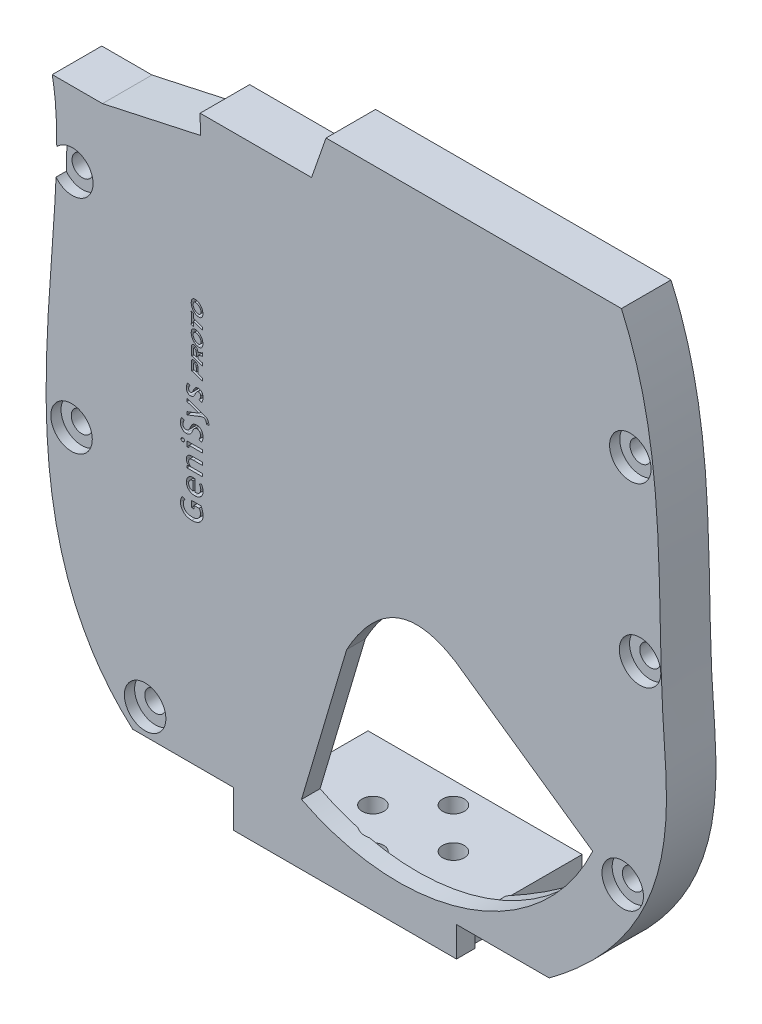
from build123d import *

# Parameters (mm, degrees)
BOSS_EXTRUDE1_DEPTH             = 3
BOSS_EXTRUDE4_DEPTH             = 5
BOSS_EXTRUDE4_DEPTH_BACK        = 3
BOSS_EXTRUDE7_DEPTH             = 5
CUT_EXTRUDE3_DEPTH              = 2
CUT_EXTRUDE4_DEPTH              = 10
BOSS_EXTRUDE10_DEPTH            = 18
SKETCH33_R                      = 1.75
CUT_EXTRUDE5_DEPTH              = 10
CBORE_FOR_M3_SBHCS1_D           = 3.4
CBORE_FOR_M3_SBHCS1_CBORE_D     = 6.7
CBORE_FOR_M3_SBHCS1_CBORE_DEPTH = 1.65


with BuildPart() as part:
    # Sketch2 → Boss-Extrude1 (new body)
    with BuildSketch(Plane.XY):
        with BuildLine():
            Line((-18, 0), (18, 0))
            Line((18, 0), (18, 4.836914336))
            add(Edge.make_bspline(
                [(18, 4.836914336), (37.380625633, 15.409845027), (45.322930289, 29.930225685), (41.679957463, 63.651017766), (44.319251731, 88.857362114), (35.71, 104.336914336)],
                knots=[0, 0, 0, 0, 0.323625535, 0.459677627, 1, 1, 1, 1], degree=3))
            Line((35.71, 104.336914336), (-3.08, 104.336914336))
            Line((-3.08, 104.336914336), (-5.419744744, 97.636914336))
            Line((-5.419744744, 97.636914336), (-23.419744744, 97.636914336))
            Line((-23.419744744, 97.636914336), (-23.373655315, 94.549308301))
            Line((-23.373655315, 94.549308301), (-39.2, 91.09))
            add(Edge.make_bspline(
                [(-18, 6), (-53.121158199, 16.995680156), (-35.208420661, 66.999525978), (-39.2, 91.09)],
                knots=[0, 0, 0, 0, 1, 1, 1, 1], degree=3))
            Line((-18, 6), (-18, 0))
        make_face()
    extrude(amount=BOSS_EXTRUDE1_DEPTH)

    # Sketch28 → Boss-Extrude4 (add, two sides: drawn at the far end of the back side and taken through both)
    with BuildSketch(Plane(origin=(0, 0, 0), x_dir=(-1, 0, 0), z_dir=(0, 0, -1)).offset(-BOSS_EXTRUDE4_DEPTH_BACK)):
        with BuildLine():
            Line((47.309202068, 91.090792508), (39.196374273, 91.090792508))
            Line((39.196374273, 91.090792508), (39.2, 91.09))
            add(Edge.make_bspline(
                [(18, 6), (53.121158199, 16.995680156), (35.208420661, 66.999525978), (39.2, 91.09)],
                knots=[0, 0, 0, 0, 1, 1, 1, 1], degree=3))
            Line((18, 6), (34.324522808, 6))
            add(Edge.make_bspline(
                [(34.324522808, 6), (34.710476867, 6.338122079), (35.089813196, 6.68564224), (35.861271612, 7.425070099), (36.253287697, 7.819381746), (38.154294646, 9.825947575), (39.498874057, 11.553427664), (41.276379047, 14.31066664), (41.828910093, 15.257469231), (42.857572207, 17.204064124), (43.335105687, 18.207779639), (44.638296897, 21.2447123), (45.342785934, 23.314831976), (46.49359904, 27.526560067), (46.939622965, 29.668251594), (47.45564049, 32.923161364), (47.602240712, 34.017306332), (47.848705083, 36.203661101), (47.948818145, 37.296726295), (48.190042648, 40.575635009), (48.272350897, 42.761193174), (48.350552848, 49.317048902), (48.178837833, 53.686533106), (47.664349828, 62.424671418), (47.315948641, 66.79380397), (46.881604635, 73.345992559), (46.751882795, 75.529617692), (46.584498786, 79.894192086), (46.544428094, 82.075211354), (46.641733111, 85.342164833), (46.700811037, 86.430374904), (46.85491399, 88.060786545), (46.917328795, 88.603935987), (47.071934872, 89.689369368), (47.166837214, 90.231574504), (47.274200755, 90.87954825), (47.291701412, 90.985170379), (47.309202068, 91.090792508)],
                knots=[0.09478003, 0.09478003, 0.09478003, 0.09478003, 0.109375, 0.109375, 0.125, 0.125, 0.1875, 0.1875, 0.21875, 0.21875, 0.25, 0.25, 0.3125, 0.3125, 0.375, 0.375, 0.40625, 0.40625, 0.4375, 0.4375, 0.5, 0.5, 0.625, 0.625, 0.75, 0.75, 0.8125, 0.8125, 0.875, 0.875, 0.90625, 0.90625, 0.921875, 0.921875, 0.9375, 0.9375, 0.940542944, 0.940542944, 0.940542944, 0.940542944], degree=3))
        make_face()
        with BuildLine():
            Line((-32.970367439, 4.836914336), (-18, 4.836914336))
            add(Edge.make_bspline(
                [(-35.71, 104.336914336), (-44.319251731, 88.857362114), (-41.679957463, 63.651017766), (-45.322930289, 29.930225685), (-37.380625633, 15.409845027), (-18, 4.836914336)],
                knots=[0, 0, 0, 0, 0.540322373, 0.676374465, 1, 1, 1, 1], degree=3))
            Line((-35.71, 104.336914336), (-44.645361647, 104.336914336))
            add(Edge.make_bspline(
                [(-44.645361647, 104.336914336), (-45.50928561, 102.405404861), (-46.252744616, 100.425982513), (-47.278468517, 97.183156731), (-47.626858019, 95.946053225), (-48.254703099, 93.444428926), (-48.534648593, 92.177271412), (-49.278731363, 88.358577533), (-49.646241038, 85.800530003), (-50.482757997, 78.101033928), (-50.686553674, 72.933311766), (-50.87802142, 65.174059886), (-50.922270495, 62.587264923), (-51.042831945, 57.414293657), (-51.118749437, 54.828109734), (-51.318233974, 50.950485654), (-51.403447593, 49.658305471), (-51.5860177, 47.074179401), (-51.680152012, 45.782171343), (-51.906855288, 41.905072446), (-51.981743366, 39.31886866), (-51.768363392, 35.433278395), (-51.642603051, 34.135341032), (-51.260754649, 31.5439288), (-51.00755124, 30.268147747), (-50.052387887, 26.503368139), (-49.154170844, 24.077158358), (-47.693393498, 21.152534819), (-47.384237835, 20.572970568), (-46.740155043, 19.437611512), (-46.404399419, 18.880075909), (-45.358048071, 17.236378489), (-44.608394991, 16.179106006), (-43.015221487, 14.133991359), (-42.171698463, 13.14615112), (-40.843113933, 11.711211505), (-40.38891025, 11.239933232), (-39.464629449, 10.316247055), (-38.994990521, 9.864196902), (-36.75469722, 7.78127565), (-34.897422187, 6.263529499), (-32.970367439, 4.836914336)],
                knots=[0.073317881, 0.073317881, 0.073317881, 0.073317881, 0.125, 0.125, 0.15625, 0.15625, 0.1875, 0.1875, 0.25, 0.25, 0.375, 0.375, 0.4375, 0.4375, 0.5, 0.5, 0.53125, 0.53125, 0.5625, 0.5625, 0.625, 0.625, 0.65625, 0.65625, 0.6875, 0.6875, 0.75, 0.75, 0.765625, 0.765625, 0.78125, 0.78125, 0.8125, 0.8125, 0.84375, 0.84375, 0.859375, 0.859375, 0.875, 0.875, 0.932832597, 0.932832597, 0.932832597, 0.932832597], degree=3))
        make_face()
    extrude(amount=BOSS_EXTRUDE4_DEPTH + BOSS_EXTRUDE4_DEPTH_BACK)

    # Sketch29 → Boss-Extrude7 (add)
    with BuildSketch(Plane(origin=(0, 0, 0), x_dir=(-1, 0, 0), z_dir=(0, 0, -1))):
        Polygon((-35.71, 104.336914336), (3.08, 104.336914336), (5.419744744, 97.636914336), (23.419744744, 97.636914336), (23.373655315, 94.549308301), (39.196374273, 91.090792508), (39.737813964, 91.090792508), (38.690882818, 86.301079725), (22.35141289, 89.872546484), (5.419744744, 89.872546484), (1.56666671, 97.636914336), (-38.713431806, 97.636914336), (-38.713431806, 104.336914336), align=None)
    extrude(amount=BOSS_EXTRUDE7_DEPTH)

    # Sketch21 → Cut-Extrude3 (cut)
    # profile 1 of 13: a face of its own
    with BuildSketch(Plane.XY.offset(3)):
        with BuildLine():
            Line((-23.156960227, 57.321623533), (-23.590909091, 57.480004215))
            add(Edge.make_bspline(
                [(-23.590909091, 57.480004215), (-23.569337782, 57.510601753), (-23.52789603, 57.56938426), (-23.472461528, 57.656846099), (-23.425100942, 57.739348297), (-23.38646606, 57.817545531), (-23.356367535, 57.891341974), (-23.334823068, 57.960423206), (-23.3209322, 58.02490432), (-23.319071947, 58.066591194), (-23.318181818, 58.086538305)],
                knots=[0, 0, 0, 0, 1.332253382, 2.559460521, 3.683996021, 4.716505285, 5.661560423, 6.517070436, 7.290420287, 8, 8, 8, 8], degree=3))
            add(Edge.make_bspline(
                [(-23.318181818, 58.086538305), (-23.319100856, 58.119301235), (-23.320827, 58.180836801), (-23.337909708, 58.266731684), (-23.365608564, 58.340371734), (-23.407217156, 58.400181412), (-23.459927925, 58.447627653), (-23.524950244, 58.480105994), (-23.600801601, 58.500660835), (-23.655154849, 58.502478692), (-23.683948864, 58.503441715)],
                knots=[0, 0, 0, 0, 1.237415283, 2.324122124, 3.296572087, 4.190537608, 5.052884192, 5.949713559, 6.91384635, 8, 8, 8, 8], degree=3))
            add(Edge.make_bspline(
                [(-23.683948864, 58.503441715), (-23.705641028, 58.502238626), (-23.748942185, 58.499837063), (-23.81214507, 58.479304483), (-23.872565694, 58.446641863), (-23.930513226, 58.401142295), (-23.985058233, 58.342563125), (-24.03797459, 58.272169375), (-24.088222845, 58.188682826), (-24.117931053, 58.127284528), (-24.133522727, 58.095061033)],
                knots=[0, 0, 0, 0, 0.810114072, 1.617122017, 2.46134648, 3.37043313, 4.360517749, 5.448424735, 6.660863975, 8, 8, 8, 8], degree=3))
            add(Edge.make_bspline(
                [(-24.133522727, 58.095061033), (-24.144988166, 58.069902429), (-24.167036316, 58.02152219), (-24.200945017, 57.952868146), (-24.230958614, 57.889761849), (-24.259335515, 57.833252654), (-24.286530054, 57.78389002), (-24.310479056, 57.740315819), (-24.332414322, 57.703299876), (-24.370524459, 57.644794509), (-24.430814856, 57.567710948), (-24.507394226, 57.494219231), (-24.572231306, 57.443527501), (-24.621980592, 57.410262715), (-24.674325403, 57.383723099), (-24.727376439, 57.360364701), (-24.782828147, 57.343684921), (-24.839429892, 57.330451925), (-24.898507937, 57.323566073), (-24.938432237, 57.322279904), (-24.958806818, 57.321623533)],
                knots=[0, 0, 0, 0, 1.237176653, 2.379102707, 3.42627846, 4.364397655, 5.20822556, 5.948084069, 6.589455019, 7.133077897, 9.07229801, 10.952987815, 11.866373839, 12.75376906, 13.625661343, 14.48953546, 15.344003742, 16.212736399, 17.087905155, 18, 18, 18, 18], degree=3))
            add(Edge.make_bspline(
                [(-24.958806818, 57.321623533), (-24.984642717, 57.32230633), (-25.035358299, 57.323646654), (-25.109326111, 57.334120878), (-25.178462429, 57.352904798), (-25.243558162, 57.37775651), (-25.303999426, 57.410732925), (-25.3604883, 57.450533188), (-25.411934102, 57.498084693), (-25.458873922, 57.552140486), (-25.500203855, 57.612252997), (-25.536763701, 57.676896023), (-25.568442874, 57.745802106), (-25.592484089, 57.819932194), (-25.613195184, 57.897764459), (-25.625820399, 57.980399263), (-25.634906749, 58.067159972), (-25.635870988, 58.126521745), (-25.636363636, 58.156850805)],
                knots=[0, 0, 0, 0, 1.022815029, 2.007774513, 2.94912665, 3.85431422, 4.760278026, 5.667985935, 6.583549178, 7.527092298, 8.496994133, 9.466669456, 10.465096674, 11.493694115, 12.548607393, 13.65045375, 14.799572086, 16, 16, 16, 16], degree=3))
            add(Edge.make_bspline(
                [(-25.636363636, 58.156850805), (-25.635702815, 58.181013003), (-25.634332779, 58.231106805), (-25.626458565, 58.308772822), (-25.61174563, 58.3908974), (-25.592513568, 58.477608715), (-25.5683925, 58.568684698), (-25.538208399, 58.664065369), (-25.502750863, 58.764300631), (-25.475622966, 58.832133315), (-25.461647727, 58.867078078)],
                knots=[0, 0, 0, 0, 0.788460219, 1.634659668, 2.543871052, 3.509008366, 4.531973241, 5.616647621, 6.772189449, 8, 8, 8, 8], degree=3))
            Line((-25.461647727, 58.867078078), (-25.045454545, 58.739237169))
            add(Edge.make_bspline(
                [(-25.045454545, 58.739237169), (-25.063524827, 58.717227522), (-25.098768417, 58.674300745), (-25.145236834, 58.607192636), (-25.184137743, 58.539838651), (-25.216749819, 58.472609309), (-25.241491765, 58.405220228), (-25.259586631, 58.33776275), (-25.270633652, 58.270143278), (-25.272031946, 58.224835463), (-25.272727273, 58.202305351)],
                knots=[0, 0, 0, 0, 1.147535307, 2.238109229, 3.285624631, 4.280117791, 5.246232794, 6.174419652, 7.092197899, 8, 8, 8, 8], degree=3))
            add(Edge.make_bspline(
                [(-25.272727273, 58.202305351), (-25.271890427, 58.176409431), (-25.270278197, 58.126519465), (-25.254570207, 58.055078665), (-25.230899832, 57.989336029), (-25.196065442, 57.931578627), (-25.154387751, 57.882942557), (-25.105487091, 57.847671651), (-25.051234788, 57.825630688), (-25.012985902, 57.822971003), (-24.993607955, 57.821623533)],
                knots=[0, 0, 0, 0, 1.185135047, 2.283230277, 3.337288491, 4.37377596, 5.357762528, 6.252052635, 7.114441336, 8, 8, 8, 8], degree=3))
            add(Edge.make_bspline(
                [(-24.993607955, 57.821623533), (-24.972930935, 57.822344835), (-24.932296319, 57.823762342), (-24.873578561, 57.837838785), (-24.81886404, 57.859935874), (-24.768193327, 57.891118175), (-24.72192189, 57.931562687), (-24.679133503, 57.980215074), (-24.640371511, 58.037825299), (-24.619063124, 58.08058294), (-24.607954545, 58.102873533)],
                knots=[0, 0, 0, 0, 0.977472815, 1.920936105, 2.840937217, 3.761757322, 4.723421608, 5.73989644, 6.821753339, 8, 8, 8, 8], degree=3))
            Line((-24.607954545, 58.102873533), (-24.454545455, 58.429578078))
            add(Edge.make_bspline(
                [(-24.454545455, 58.429578078), (-24.431871982, 58.476756799), (-24.38870156, 58.566585353), (-24.311546138, 58.686413411), (-24.230485437, 58.78672691), (-24.143559464, 58.868050858), (-24.046902542, 58.929360514), (-23.940323755, 58.973150374), (-23.822239469, 58.998933225), (-23.739949967, 59.001906081), (-23.697443182, 59.003441715)],
                knots=[0, 0, 0, 0, 1.237288181, 2.355803767, 3.362588053, 4.282183816, 5.158430962, 6.054936231, 6.995273942, 8, 8, 8, 8], degree=3))
            add(Edge.make_bspline(
                [(-23.697443182, 59.003441715), (-23.669235089, 59.002831811), (-23.613997832, 59.001637494), (-23.533458631, 58.990186319), (-23.457703494, 58.970649472), (-23.386045128, 58.945133705), (-23.320630968, 58.909152445), (-23.258421198, 58.868352647), (-23.202574659, 58.817687468), (-23.150292232, 58.761095779), (-23.10458381, 58.696764306), (-23.063504589, 58.627261565), (-23.030768261, 58.550963746), (-23.001513507, 58.469952525), (-22.981028079, 58.382131977), (-22.965218376, 58.288955718), (-22.955912583, 58.189710115), (-22.955009999, 58.121595659), (-22.954545455, 58.086538305)],
                knots=[0, 0, 0, 0, 1.014028567, 1.985676829, 2.916948868, 3.824730404, 4.712162389, 5.595295866, 6.493928734, 7.415970737, 8.361148893, 9.326360345, 10.313550045, 11.342127828, 12.420015306, 13.550933116, 14.739506858, 16, 16, 16, 16], degree=3))
            add(Edge.make_bspline(
                [(-22.954545455, 58.086538305), (-22.954952423, 58.052891429), (-22.955762468, 57.985919342), (-22.966563075, 57.886371456), (-22.981677229, 57.788298857), (-23.004106011, 57.69180693), (-23.032226032, 57.596794571), (-23.067583045, 57.503278253), (-23.108212285, 57.41091307), (-23.140664079, 57.351472497), (-23.156960227, 57.321623533)],
                knots=[0, 0, 0, 0, 1.00869075, 2.007738347, 3.000000303, 3.983534981, 4.976508054, 5.969633443, 6.980421369, 8, 8, 8, 8], degree=3))
        make_face()
    # profile 2 of 13: a face of its own
    with BuildSketch(Plane.XY.offset(3)):
        with BuildLine():
            add(Edge.make_bspline(
                [(-22.566051136, 55.621802214), (-22.545980016, 55.613926001), (-22.505876594, 55.598188809), (-22.448912703, 55.567151665), (-22.394371794, 55.530657511), (-22.342401646, 55.487713067), (-22.293017657, 55.438953209), (-22.246356573, 55.384202725), (-22.202367919, 55.323560212), (-22.160931097, 55.257671441), (-22.123679529, 55.187444735), (-22.090057638, 55.115379181), (-22.062204506, 55.04077559), (-22.039653677, 54.964306345), (-22.021819755, 54.885795731), (-22.008834691, 54.805409028), (-22.001984637, 54.722773453), (-22.000666466, 54.667030988), (-22, 54.638847668)],
                knots=[0, 0, 0, 0, 0.859822784, 1.717982667, 2.582774968, 3.475605366, 4.404312107, 5.349219551, 6.343300499, 7.391925064, 8.452948801, 9.514098743, 10.563574327, 11.627874522, 12.693725412, 13.77487837, 14.874981339, 16, 16, 16, 16], degree=3))
            Line((-22, 54.638847668), (-22.409090909, 54.638847668))
            add(Edge.make_bspline(
                [(-22.409090909, 54.638847668), (-22.410797841, 54.683921679), (-22.414120766, 54.771668335), (-22.437879463, 54.898686251), (-22.480722706, 55.014887503), (-22.528261552, 55.103513841), (-22.574038757, 55.165999348), (-22.609040058, 55.20750753), (-22.646654862, 55.242106975), (-22.685727215, 55.270889733), (-22.727311547, 55.2932921), (-22.770992413, 55.308590778), (-22.815997103, 55.319450824), (-22.846763279, 55.320259622), (-22.862215909, 55.32066585)],
                knots=[0, 0, 0, 0, 1.800312311, 3.504711135, 5.135098203, 6.730556234, 7.502288938, 8.226435997, 8.89564527, 9.538755857, 10.160659136, 10.773874165, 11.384165626, 12, 12, 12, 12], degree=3))
            add(Edge.make_bspline(
                [(-22.862215909, 55.32066585), (-22.897072282, 55.31997831), (-22.96684215, 55.318602104), (-23.070564364, 55.303314369), (-23.173922736, 55.281105623), (-23.277358418, 55.246762204), (-23.386110941, 55.205345497), (-23.505859021, 55.16085579), (-23.637404368, 55.110446163), (-23.729176502, 55.074952868), (-23.776988636, 55.056461304)],
                knots=[0, 0, 0, 0, 0.872309452, 1.746048408, 2.620672082, 3.516973102, 4.471859384, 5.535690056, 6.71612531, 8, 8, 8, 8], degree=3))
            Line((-23.776988636, 55.056461304), (-25.545454545, 54.366120395))
            Line((-25.545454545, 54.366120395), (-25.545454545, 54.82066585))
            Line((-25.545454545, 54.82066585), (-23.579545455, 55.57066585))
            Line((-23.579545455, 55.57066585), (-25.545454545, 56.229756759))
            Line((-25.545454545, 56.229756759), (-25.545454545, 56.684302214))
            Line((-25.545454545, 56.684302214), (-22.566051136, 55.621802214))
        make_face()
    # profile 3 of 13: a face of its own
    with BuildSketch(Plane.XY.offset(3)):
        with BuildLine():
            Line((-23.181818182, 51.728799076), (-23.636363636, 51.90493544))
            add(Edge.make_bspline(
                [(-23.636363636, 51.90493544), (-23.617162385, 51.928479875), (-23.577896985, 51.976626822), (-23.527150025, 52.057712755), (-23.481055374, 52.146626688), (-23.440850763, 52.241505572), (-23.40732592, 52.337584768), (-23.381861734, 52.430440892), (-23.367002084, 52.518565856), (-23.364731862, 52.575577721), (-23.363636364, 52.603088849)],
                knots=[0, 0, 0, 0, 0.955587249, 1.954118219, 3.004079489, 4.105918394, 5.194777333, 6.205278111, 7.13395528, 8, 8, 8, 8], degree=3))
            add(Edge.make_bspline(
                [(-23.363636364, 52.603088849), (-23.363889214, 52.626081086), (-23.364383474, 52.67102522), (-23.372801674, 52.736496528), (-23.384609897, 52.798797086), (-23.401421728, 52.857656328), (-23.42385199, 52.912953964), (-23.450501978, 52.964867548), (-23.483077712, 53.012920705), (-23.519774982, 53.057318298), (-23.559953938, 53.097806464), (-23.603376507, 53.132757444), (-23.649601058, 53.161965435), (-23.697611454, 53.187463819), (-23.749482638, 53.205531808), (-23.803607989, 53.219319529), (-23.860577051, 53.227007035), (-23.899363483, 53.22819606), (-23.919034091, 53.228799076)],
                knots=[0, 0, 0, 0, 1.174072398, 2.295020961, 3.367457363, 4.412732068, 5.416943465, 6.412592031, 7.389018204, 8.377289308, 9.352515571, 10.299106193, 11.218637921, 12.143882066, 13.069995838, 14.017745409, 14.994696079, 16, 16, 16, 16], degree=3))
            add(Edge.make_bspline(
                [(-23.919034091, 53.228799076), (-23.948716014, 53.227788604), (-24.007444962, 53.225789272), (-24.093841089, 53.207253512), (-24.176786557, 53.176872529), (-24.244222487, 53.142570189), (-24.296328483, 53.104601924), (-24.336926604, 53.06733318), (-24.377770634, 53.020772936), (-24.419815374, 52.965761434), (-24.462325362, 52.901593094), (-24.505189294, 52.828184318), (-24.550329734, 52.746544622), (-24.578861027, 52.688215325), (-24.59375, 52.657776349)],
                knots=[0, 0, 0, 0, 1.130821339, 2.237454306, 3.351245269, 4.494111453, 5.108088637, 5.804657897, 6.59113963, 7.466911871, 8.443450201, 9.524185804, 10.708003492, 12, 12, 12, 12], degree=3))
            Line((-24.59375, 52.657776349), (-24.725852273, 52.374395667))
            add(Edge.make_bspline(
                [(-24.725852273, 52.374395667), (-24.739999359, 52.345360814), (-24.767474449, 52.288972152), (-24.812503757, 52.209062135), (-24.85903101, 52.135707888), (-24.908392171, 52.069646052), (-24.958497929, 52.009473099), (-25.011475007, 51.956722953), (-25.066009993, 51.910152435), (-25.123429734, 51.870905673), (-25.183058999, 51.837439521), (-25.244989862, 51.807776134), (-25.310512724, 51.784389561), (-25.378251291, 51.763080799), (-25.44933814, 51.747622152), (-25.523464091, 51.737505098), (-25.600216537, 51.729714341), (-25.652441202, 51.729107447), (-25.678977273, 51.728799076)],
                knots=[0, 0, 0, 0, 1.259710643, 2.446487182, 3.576268326, 4.645742621, 5.661511263, 6.62801309, 7.558637717, 8.455233395, 9.336138097, 10.224370941, 11.130194262, 12.047526206, 12.993152343, 13.963573299, 14.965263602, 16, 16, 16, 16], degree=3))
            add(Edge.make_bspline(
                [(-25.678977273, 51.728799076), (-25.711228463, 51.729503535), (-25.77437084, 51.730882745), (-25.866871751, 51.74510534), (-25.955219022, 51.766854562), (-26.039483234, 51.797619153), (-26.119731108, 51.836749296), (-26.195165182, 51.885563146), (-26.266827895, 51.942638913), (-26.332756736, 52.008723462), (-26.394104712, 52.080492721), (-26.446560361, 52.158892859), (-26.490752172, 52.242145697), (-26.52806175, 52.329613598), (-26.556600672, 52.422687211), (-26.575966373, 52.52076941), (-26.588466198, 52.62360219), (-26.590083652, 52.693723922), (-26.590909091, 52.729509304)],
                knots=[0, 0, 0, 0, 1.020222288, 1.997422757, 2.955321968, 3.896541244, 4.831654084, 5.775465557, 6.735209953, 7.726193581, 8.726063866, 9.719622915, 10.705350052, 11.706146754, 12.72548783, 13.780780973, 14.867460946, 16, 16, 16, 16], degree=3))
            add(Edge.make_bspline(
                [(-26.590909091, 52.729509304), (-26.590383234, 52.776631258), (-26.589372859, 52.867170762), (-26.581186522, 52.997629933), (-26.566042293, 53.11680325), (-26.547064864, 53.22529854), (-26.520540786, 53.322078898), (-26.489857079, 53.40811769), (-26.452525135, 53.483166598), (-26.421265528, 53.526274194), (-26.40625, 53.546980894)],
                knots=[0, 0, 0, 0, 1.327290856, 2.5502392, 3.679258284, 4.70991777, 5.649791681, 6.502102835, 7.280486234, 8, 8, 8, 8], degree=3))
            Line((-26.40625, 53.546980894), (-26, 53.406355894))
            add(Edge.make_bspline(
                [(-26, 53.406355894), (-26.010739635, 53.388538264), (-26.034171976, 53.349662756), (-26.064775565, 53.282386697), (-26.094956405, 53.202811402), (-26.12394957, 53.113777086), (-26.149087222, 53.020456277), (-26.167621385, 52.927719756), (-26.179770987, 52.838497638), (-26.18114862, 52.779971447), (-26.181818182, 52.751526349)],
                knots=[0, 0, 0, 0, 0.726782051, 1.585733971, 2.578613016, 3.701377312, 4.857680474, 5.954867603, 7.006017832, 8, 8, 8, 8], degree=3))
            add(Edge.make_bspline(
                [(-26.181818182, 52.751526349), (-26.181407179, 52.731862911), (-26.180602707, 52.693374901), (-26.174357229, 52.636964472), (-26.162823098, 52.584094087), (-26.147996903, 52.533954234), (-26.128141888, 52.487680577), (-26.104548027, 52.444079827), (-26.075802003, 52.404323106), (-26.032887153, 52.355595693), (-25.970307948, 52.304214531), (-25.883942887, 52.26049016), (-25.787889581, 52.232910229), (-25.72036542, 52.230202451), (-25.685369318, 52.228799076)],
                knots=[0, 0, 0, 0, 0.871337437, 1.705502555, 2.510047608, 3.266723597, 4.018876851, 4.737274488, 5.459263563, 6.187627271, 7.611533469, 9.014453204, 10.452664965, 12, 12, 12, 12], degree=3))
            add(Edge.make_bspline(
                [(-25.685369318, 52.228799076), (-25.663546188, 52.229211135), (-25.620372123, 52.230026336), (-25.557589022, 52.240466839), (-25.497524918, 52.25606227), (-25.440886725, 52.278136751), (-25.387671976, 52.305609025), (-25.338970628, 52.338697086), (-25.294588532, 52.376285178), (-25.261398351, 52.413001944), (-25.235093171, 52.446628924), (-25.213828312, 52.478375154), (-25.190520643, 52.515745966), (-25.165828503, 52.559326571), (-25.138877129, 52.60835441), (-25.109489247, 52.663029165), (-25.079329553, 52.724196175), (-25.058461154, 52.766908257), (-25.047585227, 52.789168394)],
                knots=[0, 0, 0, 0, 1.149408971, 2.273947732, 3.345710765, 4.416601263, 5.471736586, 6.49645987, 7.514548104, 8.530491701, 9.099748628, 9.764454889, 10.543742144, 11.421558589, 12.404771446, 13.493623776, 14.693758811, 16, 16, 16, 16], degree=3))
            Line((-25.047585227, 52.789168394), (-24.910511364, 53.077520667))
            add(Edge.make_bspline(
                [(-24.910511364, 53.077520667), (-24.896437349, 53.106595342), (-24.868912446, 53.163457412), (-24.822553714, 53.243291376), (-24.774945578, 53.316975929), (-24.725436637, 53.383922629), (-24.673277785, 53.443840388), (-24.619483791, 53.497435459), (-24.562980177, 53.543829716), (-24.504297616, 53.584051173), (-24.442316357, 53.618376821), (-24.377092416, 53.648283793), (-24.307609706, 53.673036837), (-24.234369415, 53.693846601), (-24.156870396, 53.709096783), (-24.075547436, 53.720423167), (-23.990430087, 53.727818394), (-23.932307279, 53.728468106), (-23.902698864, 53.728799076)],
                knots=[0, 0, 0, 0, 1.207070545, 2.360698103, 3.448068551, 4.485233798, 5.470074118, 6.4149816, 7.320314244, 8.199045901, 9.070618729, 9.965598409, 10.878168315, 11.825104165, 12.809148975, 13.827877645, 14.893496304, 16, 16, 16, 16], degree=3))
            add(Edge.make_bspline(
                [(-23.902698864, 53.728799076), (-23.870207688, 53.727873419), (-23.80629264, 53.726052511), (-23.712105534, 53.710694098), (-23.621818399, 53.685130164), (-23.535269718, 53.649420236), (-23.452975082, 53.603415763), (-23.374502742, 53.54758567), (-23.299506608, 53.481719252), (-23.229005051, 53.406145338), (-23.164631036, 53.322028198), (-23.108314022, 53.230628087), (-23.06031563, 53.13247268), (-23.02130376, 53.027314647), (-22.991957661, 52.915123465), (-22.969566419, 52.796781974), (-22.956906977, 52.671311039), (-22.955345787, 52.585360803), (-22.954545455, 52.541299076)],
                knots=[0, 0, 0, 0, 0.918229556, 1.806296171, 2.68988645, 3.566246584, 4.44719609, 5.349825016, 6.284281999, 7.264602444, 8.267358549, 9.274194767, 10.295018407, 11.351877198, 12.439738183, 13.570097331, 14.754329091, 16, 16, 16, 16], degree=3))
            add(Edge.make_bspline(
                [(-22.954545455, 52.541299076), (-22.955213199, 52.502449009), (-22.956530903, 52.425783659), (-22.967371083, 52.313063206), (-22.985030233, 52.204593031), (-23.009882198, 52.100592821), (-23.04187236, 52.000841812), (-23.080899914, 51.905546026), (-23.127199954, 51.814504125), (-23.163589101, 51.757403525), (-23.181818182, 51.728799076)],
                knots=[0, 0, 0, 0, 1.088633433, 2.148270768, 3.170329357, 4.166474596, 5.142169714, 6.103226757, 7.04981468, 8, 8, 8, 8], degree=3))
        make_face()
    # profile 4 of 13: a face of its own
    with BuildSketch(Plane.XY.offset(3)):
        with BuildLine():
            add(Edge.make_bspline(
                [(-26.5, 50.544602757), (-26.499073252, 50.562933699), (-26.497247534, 50.59904613), (-26.481910367, 50.650901963), (-26.456370802, 50.698169804), (-26.421602179, 50.73966284), (-26.379945956, 50.774308004), (-26.333443059, 50.800489208), (-26.282220523, 50.816069759), (-26.246791698, 50.817844085), (-26.228693182, 50.818750484)],
                knots=[0, 0, 0, 0, 1.025367983, 2.020001432, 2.999040558, 4.016142087, 5.033243616, 6.018639334, 6.987838621, 8, 8, 8, 8], degree=3))
            add(Edge.make_bspline(
                [(-26.228693182, 50.818750484), (-26.210371606, 50.817806732), (-26.174277627, 50.815947516), (-26.122177088, 50.800822557), (-26.075332909, 50.774270166), (-26.033593207, 50.739702732), (-25.999025773, 50.69796303), (-25.972473382, 50.651118851), (-25.957348423, 50.599018312), (-25.955489207, 50.562924333), (-25.954545455, 50.544602757)],
                knots=[0, 0, 0, 0, 1.019632885, 2.00870314, 2.988587333, 4, 5.011412667, 5.99129686, 6.980367115, 8, 8, 8, 8], degree=3))
            add(Edge.make_bspline(
                [(-25.954545455, 50.544602757), (-25.955451854, 50.526504241), (-25.95722618, 50.491075416), (-25.97280673, 50.43985288), (-25.998987935, 50.393349983), (-26.033633099, 50.351693759), (-26.075126135, 50.316925137), (-26.122393976, 50.291385572), (-26.174249809, 50.276048405), (-26.21036224, 50.274222687), (-26.228693182, 50.273295939)],
                knots=[0, 0, 0, 0, 1.012161379, 1.981360666, 2.966756384, 3.983857913, 5.000959442, 5.979998568, 6.974632017, 8, 8, 8, 8], degree=3))
            add(Edge.make_bspline(
                [(-26.228693182, 50.273295939), (-26.247036121, 50.274187353), (-26.28294456, 50.275932399), (-26.334111758, 50.291532424), (-26.38117662, 50.316278436), (-26.422227901, 50.351068038), (-26.457017503, 50.392119319), (-26.481763514, 50.439184181), (-26.49736354, 50.490351379), (-26.499108586, 50.526259818), (-26.5, 50.544602757)],
                knots=[0, 0, 0, 0, 1.029106498, 2.014595724, 2.979190096, 4, 5.020809904, 5.985404276, 6.970893502, 8, 8, 8, 8], degree=3))
        make_face()
    # profile 5 of 13: a face of its own
    with BuildSketch(Plane.XY.offset(3)):
        Polygon((-23, 50.273295939), (-25.181818182, 50.273295939), (-25.181818182, 49.909659575), (-25.545454545, 49.909659575), (-25.545454545, 50.727841393), (-23, 50.727841393), align=None)
    # profile 6 of 13: a face of its own
    with BuildSketch(Plane.XY.offset(3)):
        with BuildLine():
            Line((-23, 48.545065529), (-24.520596591, 48.545065529))
            add(Edge.make_bspline(
                [(-24.520596591, 48.545065529), (-24.553982613, 48.544605032), (-24.618437609, 48.543715998), (-24.711171371, 48.538414482), (-24.796218964, 48.528214831), (-24.873528635, 48.515461727), (-24.94294506, 48.497302458), (-25.004965517, 48.476810064), (-25.058797454, 48.450753546), (-25.105778336, 48.421824466), (-25.145843049, 48.387438338), (-25.180382563, 48.348175888), (-25.208432165, 48.30293657), (-25.232487946, 48.253089026), (-25.250586773, 48.197900626), (-25.263239584, 48.137390577), (-25.271107282, 48.071786363), (-25.272173584, 48.026149403), (-25.272727273, 48.002451892)],
                knots=[0, 0, 0, 0, 1.492106002, 2.880657212, 4.14835034, 5.318950215, 6.378739036, 7.352378912, 8.232549213, 9.045621216, 9.811040052, 10.583374037, 11.372908143, 12.182116238, 13.051988803, 13.960877007, 14.941162183, 16, 16, 16, 16], degree=3))
            add(Edge.make_bspline(
                [(-25.272727273, 48.002451892), (-25.271714017, 47.975823409), (-25.269636815, 47.921234333), (-25.249357195, 47.839442822), (-25.22049518, 47.755216622), (-25.178649914, 47.672124036), (-25.129587037, 47.592203571), (-25.073095848, 47.520979079), (-25.012095468, 47.458453588), (-24.965946911, 47.425136981), (-24.943181818, 47.408701892)],
                knots=[0, 0, 0, 0, 0.907673559, 1.860754108, 2.862929001, 3.943871235, 5.029518487, 6.059698139, 7.042848705, 8, 8, 8, 8], degree=3))
            Line((-24.943181818, 47.408701892), (-23, 47.408701892))
            Line((-23, 47.408701892), (-23, 46.954156438))
            Line((-23, 46.954156438), (-25.545454545, 46.954156438))
            Line((-25.545454545, 46.954156438), (-25.545454545, 47.267366665))
            Line((-25.545454545, 47.267366665), (-25.214488636, 47.412253029))
            add(Edge.make_bspline(
                [(-25.214488636, 47.412253029), (-25.247956396, 47.431765029), (-25.313306034, 47.469864446), (-25.400081753, 47.540237493), (-25.473572985, 47.619735789), (-25.533118306, 47.709055462), (-25.579434765, 47.807255606), (-25.612972655, 47.914231913), (-25.633114672, 48.030101679), (-25.635259889, 48.110324014), (-25.636363636, 48.15159962)],
                knots=[0, 0, 0, 0, 1.033179765, 2.01740193, 2.970272673, 3.913450097, 4.871943902, 5.859509463, 6.898685209, 8, 8, 8, 8], degree=3))
            add(Edge.make_bspline(
                [(-25.636363636, 48.15159962), (-25.635560215, 48.185968395), (-25.634003519, 48.252560816), (-25.621592806, 48.349045127), (-25.602346093, 48.438999292), (-25.573333521, 48.522151178), (-25.537544142, 48.599345699), (-25.492425952, 48.669455444), (-25.438969082, 48.732402058), (-25.378808529, 48.790022118), (-25.308601432, 48.838676282), (-25.23189527, 48.882462034), (-25.146416037, 48.918561368), (-25.053162996, 48.948123319), (-24.951803929, 48.971734664), (-24.842254482, 48.987447185), (-24.72485924, 48.997600432), (-24.643961884, 48.998927236), (-24.602272727, 48.999610983)],
                knots=[0, 0, 0, 0, 1.078049181, 2.088811887, 3.047630769, 3.959124913, 4.846352359, 5.711792439, 6.565904407, 7.433000711, 8.317268906, 9.238668105, 10.200417668, 11.222337962, 12.305289945, 13.461961816, 14.692062682, 16, 16, 16, 16], degree=3))
            Line((-24.602272727, 48.999610983), (-23, 48.999610983))
            Line((-23, 48.999610983), (-23, 48.545065529))
        make_face()
    # profile 7 of 13: a face of its own
    with BuildSketch(Plane.XY.offset(3)):
        with BuildLine():
            Line((-24.272727273, 46.053340801), (-24.272727273, 44.180471482))
            add(Edge.make_bspline(
                [(-24.272727273, 44.180471482), (-24.234114269, 44.181379743), (-24.159084177, 44.183144611), (-24.04995562, 44.194189997), (-23.947798409, 44.214192483), (-23.852684776, 44.241692086), (-23.763962128, 44.276693909), (-23.682395272, 44.319855566), (-23.607390983, 44.371266315), (-23.563239286, 44.411701557), (-23.541193182, 44.431891937)],
                knots=[0, 0, 0, 0, 1.167743632, 2.269077844, 3.312287398, 4.311428691, 5.259316273, 6.191281003, 7.096859012, 8, 8, 8, 8], degree=3))
            add(Edge.make_bspline(
                [(-23.541193182, 44.431891937), (-23.523173807, 44.450644816), (-23.487512511, 44.487757755), (-23.443099542, 44.550521264), (-23.404282518, 44.616181663), (-23.372141089, 44.685746688), (-23.347900712, 44.759680447), (-23.331271804, 44.837326068), (-23.320038955, 44.918783222), (-23.31880979, 44.974466485), (-23.318181818, 45.002914664)],
                knots=[0, 0, 0, 0, 0.989736879, 1.958741593, 2.921088718, 3.893907189, 4.872397632, 5.879253614, 6.916525902, 8, 8, 8, 8], degree=3))
            add(Edge.make_bspline(
                [(-23.318181818, 45.002914664), (-23.318831486, 45.035379408), (-23.320106011, 45.099069135), (-23.331100539, 45.192649314), (-23.34863597, 45.282261251), (-23.373538435, 45.367858141), (-23.405555446, 45.449220042), (-23.44483508, 45.526237057), (-23.491101407, 45.599372111), (-23.52725456, 45.644339815), (-23.545454545, 45.666977164)],
                knots=[0, 0, 0, 0, 1.086166282, 2.13085413, 3.148605832, 4.138974104, 5.110011886, 6.070258581, 7.028542114, 8, 8, 8, 8], degree=3))
            Line((-23.545454545, 45.666977164), (-23.227272727, 45.862289664))
            add(Edge.make_bspline(
                [(-23.227272727, 45.862289664), (-23.210309133, 45.842380823), (-23.174163268, 45.799959254), (-23.130083133, 45.722359798), (-23.08686524, 45.632259624), (-23.063934875, 45.565701313), (-23.051846591, 45.530613528)],
                knots=[0, 0, 0, 0, 0.829008863, 1.766444218, 2.822528312, 4, 4, 4, 4], degree=3))
            add(Edge.make_bspline(
                [(-23.051846591, 45.530613528), (-23.036726997, 45.483035897), (-23.005945746, 45.386174893), (-22.976302997, 45.233558663), (-22.958366684, 45.073188915), (-22.955837039, 44.963664894), (-22.954545455, 44.90774421)],
                knots=[0, 0, 0, 0, 0.945414737, 1.92472428, 2.940407449, 4, 4, 4, 4], degree=3))
            add(Edge.make_bspline(
                [(-22.954545455, 44.90774421), (-22.955432244, 44.867213177), (-22.957181557, 44.787260167), (-22.973088304, 44.669707502), (-22.999725113, 44.557221856), (-23.034886797, 44.448792778), (-23.082254754, 44.345786687), (-23.139481571, 44.247063714), (-23.206840801, 44.152869485), (-23.259117141, 44.095227977), (-23.285511364, 44.066124892)],
                knots=[0, 0, 0, 0, 1.048151851, 2.067623015, 3.061458936, 4.035625823, 5.011331618, 5.988247597, 6.984270095, 8, 8, 8, 8], degree=3))
            add(Edge.make_bspline(
                [(-23.285511364, 44.066124892), (-23.316601467, 44.035355311), (-23.378442794, 43.974151537), (-23.482104478, 43.895155011), (-23.593579624, 43.828867106), (-23.712876978, 43.774389254), (-23.839937921, 43.731700137), (-23.975277968, 43.702508321), (-24.117808867, 43.68311817), (-24.215605276, 43.681367099), (-24.265625, 43.680471482)],
                knots=[0, 0, 0, 0, 0.967457081, 1.924368929, 2.876086972, 3.832797923, 4.822091066, 5.83665359, 6.893517769, 8, 8, 8, 8], degree=3))
            add(Edge.make_bspline(
                [(-24.265625, 43.680471482), (-24.31752708, 43.68170607), (-24.41930099, 43.684126951), (-24.567881657, 43.702869619), (-24.708667785, 43.733295731), (-24.841672699, 43.775780253), (-24.966558162, 43.831559991), (-25.083516626, 43.899245943), (-25.192978734, 43.979190037), (-25.258243185, 44.041678618), (-25.291193182, 44.073227164)],
                knots=[0, 0, 0, 0, 1.103286409, 2.163415646, 3.178379871, 4.162134233, 5.126549343, 6.08055717, 7.030932849, 8, 8, 8, 8], degree=3))
            add(Edge.make_bspline(
                [(-25.291193182, 44.073227164), (-25.318734787, 44.102817141), (-25.372904496, 44.161015651), (-25.443566619, 44.255315337), (-25.502964993, 44.353889683), (-25.551138029, 44.456664945), (-25.590200558, 44.562903104), (-25.617102879, 44.673681093), (-25.632807127, 44.788446784), (-25.635169278, 44.866266222), (-25.636363636, 44.905613528)],
                knots=[0, 0, 0, 0, 1.048034946, 2.061308578, 3.050246833, 4.028198569, 5.001453651, 5.981504803, 6.979402185, 8, 8, 8, 8], degree=3))
            add(Edge.make_bspline(
                [(-25.636363636, 44.905613528), (-25.635383373, 44.950866572), (-25.633469143, 45.039235448), (-25.619324493, 45.168061576), (-25.595112892, 45.289452621), (-25.561884688, 45.403406441), (-25.519407929, 45.510071623), (-25.466267767, 45.608729551), (-25.404090385, 45.700403307), (-25.354826554, 45.75486875), (-25.330255682, 45.782033982)],
                knots=[0, 0, 0, 0, 1.140665541, 2.227459699, 3.262123076, 4.257359294, 5.215990926, 6.15052194, 7.077552707, 8, 8, 8, 8], degree=3))
            add(Edge.make_bspline(
                [(-25.330255682, 45.782033982), (-25.30518965, 45.806513729), (-25.255441708, 45.855098084), (-25.172101486, 45.917756057), (-25.083039097, 45.971493879), (-24.987380627, 46.014847881), (-24.885842886, 46.048127545), (-24.77865379, 46.072456381), (-24.665390471, 46.086643757), (-24.587871208, 46.088575952), (-24.548295455, 46.089562392)],
                knots=[0, 0, 0, 0, 0.971813225, 1.928734025, 2.886782605, 3.854408881, 4.837446585, 5.848277975, 6.901485685, 8, 8, 8, 8], degree=3))
            add(Edge.make_bspline(
                [(-24.548295455, 46.089562392), (-24.523891298, 46.089225334), (-24.475685709, 46.088559542), (-24.405236001, 46.081167434), (-24.337548301, 46.07001899), (-24.294201977, 46.058866156), (-24.272727273, 46.053340801)],
                knots=[0, 0, 0, 0, 1.050083884, 2.074233296, 3.045933618, 4, 4, 4, 4], degree=3))
        make_face()
        with BuildLine():
            add(Edge.make_bspline(
                [(-25.272727273, 44.93118171), (-25.272340399, 44.905573844), (-25.271581424, 44.855335981), (-25.260932433, 44.781974605), (-25.24560271, 44.711740012), (-25.223418464, 44.644649587), (-25.194885186, 44.580404293), (-25.159997327, 44.519218256), (-25.118806256, 44.461153328), (-25.086567575, 44.42611907), (-25.0703125, 44.408454437)],
                knots=[0, 0, 0, 0, 1.06759705, 2.094426531, 3.086601989, 4.06436251, 5.037270591, 6.015031111, 6.999158234, 8, 8, 8, 8], degree=3))
            add(Edge.make_bspline(
                [(-25.0703125, 44.408454437), (-25.05404553, 44.392253783), (-25.02189023, 44.360229571), (-24.968672041, 44.318449025), (-24.913244488, 44.280950049), (-24.854247271, 44.249984444), (-24.7924521, 44.224087532), (-24.728054721, 44.203664824), (-24.660602211, 44.188266697), (-24.614417373, 44.183100897), (-24.590909091, 44.180471482)],
                knots=[0, 0, 0, 0, 1.014452497, 2.005292046, 2.986739539, 3.97025095, 4.946323062, 5.946247264, 6.954630981, 8, 8, 8, 8], degree=3))
            Line((-24.590909091, 44.180471482), (-24.590909091, 45.635016937))
            add(Edge.make_bspline(
                [(-24.590909091, 45.635016937), (-24.614138967, 45.63450364), (-24.659812703, 45.633494413), (-24.726543324, 45.624605986), (-24.790528131, 45.61120022), (-24.851549408, 45.592224671), (-24.909680852, 45.566880285), (-24.96509048, 45.536580581), (-25.017249385, 45.500080448), (-25.049245629, 45.472196827), (-25.065340909, 45.458170346)],
                knots=[0, 0, 0, 0, 1.074154994, 2.111964356, 3.108624356, 4.095792429, 5.062147245, 6.037581814, 7.012831928, 8, 8, 8, 8], degree=3))
            add(Edge.make_bspline(
                [(-25.065340909, 45.458170346), (-25.081780488, 45.441678099), (-25.114543572, 45.408810049), (-25.157561184, 45.353890818), (-25.192767121, 45.293859221), (-25.222456312, 45.229995621), (-25.244916153, 45.161535847), (-25.261532323, 45.088585645), (-25.270363544, 45.01117997), (-25.271929253, 44.958189975), (-25.272727273, 44.93118171)],
                knots=[0, 0, 0, 0, 0.95760174, 1.908442216, 2.860628821, 3.81510446, 4.800779991, 5.819262726, 6.888508446, 8, 8, 8, 8], degree=3))
        make_face(mode=Mode.SUBTRACT)
    # profile 8 of 13: a face of its own
    with BuildSketch(Plane.XY.offset(3)):
        with BuildLine():
            Line((-26.272727273, 42.588604709), (-25.877130682, 42.3904513))
            add(Edge.make_bspline(
                [(-25.877130682, 42.3904513), (-25.897894902, 42.360650551), (-25.938441117, 42.30245874), (-25.991096311, 42.212704004), (-26.035285455, 42.12329002), (-26.072551696, 42.034811923), (-26.101348457, 41.946236809), (-26.120997903, 41.857973599), (-26.133715093, 41.77031681), (-26.135485633, 41.711989309), (-26.136363636, 41.683064936)],
                knots=[0, 0, 0, 0, 1.138088977, 2.222342099, 3.257682648, 4.262253995, 5.229037171, 6.172298606, 7.093650264, 8, 8, 8, 8], degree=3))
            add(Edge.make_bspline(
                [(-26.136363636, 41.683064936), (-26.135048832, 41.638503287), (-26.132471462, 41.551150455), (-26.114856517, 41.423656256), (-26.08429144, 41.303593723), (-26.041248664, 41.190927955), (-25.986369471, 41.08525355), (-25.919312993, 40.986629737), (-25.839574488, 40.895904121), (-25.748586452, 40.812776521), (-25.647222239, 40.738960159), (-25.538018816, 40.673383853), (-25.419943061, 40.6198824), (-25.294623078, 40.574842619), (-25.161237219, 40.540185233), (-25.020155633, 40.515582392), (-24.871308992, 40.500377146), (-24.769449986, 40.498603287), (-24.717329545, 40.497695618)],
                knots=[0, 0, 0, 0, 1.026079095, 2.011391361, 2.956788508, 3.87306691, 4.782573646, 5.692847974, 6.612380394, 7.557777541, 8.524945456, 9.495426439, 10.485778159, 11.504881987, 12.558752999, 13.654909112, 14.800035718, 16, 16, 16, 16], degree=3))
            add(Edge.make_bspline(
                [(-24.717329545, 40.497695618), (-24.667816885, 40.498671435), (-24.570949649, 40.500580537), (-24.429179695, 40.514882271), (-24.294696855, 40.538762735), (-24.167680397, 40.572710449), (-24.048503124, 40.617106937), (-23.936250211, 40.670321206), (-23.831635951, 40.733739214), (-23.734928194, 40.806151879), (-23.647498349, 40.886613959), (-23.571627375, 40.975437924), (-23.507270762, 41.071235364), (-23.454255786, 41.174075983), (-23.413774828, 41.284398509), (-23.384941391, 41.401339152), (-23.366449919, 41.525281208), (-23.364590407, 41.610317064), (-23.363636364, 41.653945618)],
                knots=[0, 0, 0, 0, 1.1840151, 2.316423095, 3.403712845, 4.447544125, 5.456153658, 6.441303757, 7.414273256, 8.37680802, 9.326349121, 10.249996622, 11.163944387, 12.08062402, 13.010377291, 13.96751807, 14.957213442, 16, 16, 16, 16], degree=3))
            add(Edge.make_bspline(
                [(-23.363636364, 41.653945618), (-23.364281952, 41.684990517), (-23.365542638, 41.745614116), (-23.376454011, 41.834269205), (-23.394178076, 41.918406043), (-23.418657723, 41.998398782), (-23.45198352, 42.073188977), (-23.490967821, 42.144247347), (-23.537814619, 42.210408265), (-23.57415418, 42.250413916), (-23.592329545, 42.270422891)],
                knots=[0, 0, 0, 0, 1.10396676, 2.155794964, 3.171541069, 4.159684057, 5.125029612, 6.078734945, 7.039072189, 8, 8, 8, 8], degree=3))
            Line((-23.592329545, 42.270422891), (-24.409090909, 42.270422891))
            Line((-24.409090909, 42.270422891), (-24.409090909, 41.770422891))
            Line((-24.409090909, 41.770422891), (-24.818181818, 41.770422891))
            Line((-24.818181818, 41.770422891), (-24.818181818, 42.770422891))
            Line((-24.818181818, 42.770422891), (-23.311079545, 42.770422891))
            add(Edge.make_bspline(
                [(-23.311079545, 42.770422891), (-23.297894542, 42.753742533), (-23.270986282, 42.719700875), (-23.232823645, 42.664974826), (-23.199001998, 42.604325202), (-23.164699163, 42.540196782), (-23.134267869, 42.470481427), (-23.103792006, 42.396745075), (-23.077374251, 42.317448635), (-23.043377018, 42.207005412), (-23.008885827, 42.066458323), (-22.976583534, 41.89855494), (-22.95877414, 41.732457812), (-22.955946573, 41.622496319), (-22.954545455, 41.568008118)],
                knots=[0, 0, 0, 0, 0.600347454, 1.225202937, 1.88104081, 2.559747038, 3.277833053, 4.027578583, 4.811841486, 5.636512805, 7.290184433, 8.894927138, 10.46137197, 12, 12, 12, 12], degree=3))
            add(Edge.make_bspline(
                [(-22.954545455, 41.568008118), (-22.95605793, 41.508989732), (-22.959015625, 41.39357737), (-22.981793215, 41.224951783), (-23.020926939, 41.065997432), (-23.075020866, 40.916608591), (-23.144181436, 40.776538655), (-23.23031881, 40.646916387), (-23.330844341, 40.525928808), (-23.446990474, 40.416278414), (-23.575232468, 40.317690225), (-23.714675965, 40.232167753), (-23.86385902, 40.159551919), (-24.02307156, 40.099596373), (-24.192897592, 40.0534931), (-24.372850542, 40.021561594), (-24.562728898, 40.000895199), (-24.692652135, 39.998779721), (-24.759232955, 39.997695618)],
                knots=[0, 0, 0, 0, 1.049219982, 2.05178362, 3.018661302, 3.954837775, 4.871667558, 5.789366713, 6.715886867, 7.662763385, 8.623463107, 9.58732111, 10.566320126, 11.569458059, 12.608042762, 13.69053971, 14.816487638, 16, 16, 16, 16], degree=3))
            add(Edge.make_bspline(
                [(-24.759232955, 39.997695618), (-24.82557837, 39.999012527), (-24.955546414, 40.0015923), (-25.145886258, 40.023192512), (-25.326552977, 40.059052072), (-25.497653978, 40.109907664), (-25.659213296, 40.17412585), (-25.810846438, 40.253711163), (-25.953134762, 40.347128859), (-26.084640146, 40.454821496), (-26.204085771, 40.574220305), (-26.307698088, 40.705230962), (-26.395775257, 40.845811832), (-26.467140201, 40.997056883), (-26.522439945, 41.158153546), (-26.562087472, 41.329238794), (-26.586875543, 41.510226191), (-26.589544289, 41.634450955), (-26.590909091, 41.697979709)],
                knots=[0, 0, 0, 0, 1.130283011, 2.214179687, 3.259305657, 4.265113137, 5.25170896, 6.217086086, 7.178214056, 8.147250874, 9.108573549, 10.050477018, 10.987391153, 11.929355094, 12.893846765, 13.88412247, 14.917936669, 16, 16, 16, 16], degree=3))
            add(Edge.make_bspline(
                [(-26.590909091, 41.697979709), (-26.589996651, 41.742530361), (-26.588210099, 41.829760261), (-26.572980126, 41.957362908), (-26.54819622, 42.078819247), (-26.51360818, 42.194034358), (-26.468658931, 42.302812319), (-26.413368543, 42.404883317), (-26.34930369, 42.501532145), (-26.298275784, 42.559554324), (-26.272727273, 42.588604709)],
                knots=[0, 0, 0, 0, 1.103258981, 2.160174231, 3.178020786, 4.170549767, 5.13546014, 6.087904721, 7.042657388, 8, 8, 8, 8], degree=3))
        make_face()
    # profile 9 of 13: a face of its own
    with BuildSketch(Plane.XY.offset(3)):
        with BuildLine():
            Line((-23.739317491, 60.984817869), (-23.145792135, 60.782859912))
            add(Edge.make_bspline(
                [(-23.145792135, 60.782859912), (-23.139598987, 60.78091107), (-23.128160241, 60.777311558), (-23.111599566, 60.775478002), (-23.097210861, 60.775363986), (-23.084608651, 60.779097759), (-23.073717405, 60.786312528), (-23.06456013, 60.796974769), (-23.056986834, 60.811074669), (-23.053098144, 60.821704282), (-23.050987413, 60.827473899)],
                knots=[0, 0, 0, 0, 1.269219168, 2.344248245, 3.255578801, 4.070780735, 4.879307412, 5.782799223, 6.796531998, 8, 8, 8, 8], degree=3))
            Line((-23.050987413, 60.827473899), (-23, 60.809946975))
            Line((-23, 60.809946975), (-23, 60.24908543))
            Line((-23, 60.24908543), (-23.050987413, 60.266612353))
            add(Edge.make_bspline(
                [(-23.050987413, 60.266612353), (-23.053252069, 60.274090609), (-23.057518741, 60.288179842), (-23.065496815, 60.307599798), (-23.074613848, 60.324144751), (-23.088666075, 60.342609979), (-23.112086134, 60.362096517), (-23.134809719, 60.370731506), (-23.146987152, 60.375358946)],
                knots=[0, 0, 0, 0, 0.922177638, 1.737407128, 2.474415929, 3.145441812, 4.470259305, 6, 6, 6, 6], degree=3))
            Line((-23.146987152, 60.375358946), (-24.687364705, 60.899174948))
            add(Edge.make_bspline(
                [(-24.687364705, 60.899174948), (-24.693821837, 60.901229142), (-24.70565473, 60.904993516), (-24.722867883, 60.907502811), (-24.737604566, 60.907360328), (-24.750407968, 60.904275849), (-24.761198226, 60.897199121), (-24.770140028, 60.886547729), (-24.778298605, 60.872515837), (-24.782346954, 60.8616787), (-24.784559462, 60.855755979)],
                knots=[0, 0, 0, 0, 1.303221935, 2.388194255, 3.334742359, 4.128743128, 4.887793086, 5.775512933, 6.784271422, 8, 8, 8, 8], degree=3))
            Line((-24.784559462, 60.855755979), (-24.835546875, 60.872884563))
            Line((-24.835546875, 60.872884563), (-24.835546875, 62.013727934))
            add(Edge.make_bspline(
                [(-24.835546875, 62.013727934), (-24.835459554, 62.029926918), (-24.835290614, 62.061267388), (-24.834302725, 62.106839328), (-24.831567786, 62.149568176), (-24.829266173, 62.189474766), (-24.824869928, 62.226466241), (-24.820875478, 62.260692723), (-24.815237472, 62.292039804), (-24.806893972, 62.329365571), (-24.794049007, 62.372159325), (-24.772477343, 62.418545576), (-24.747548111, 62.460893498), (-24.725904919, 62.484495655), (-24.715248447, 62.496116663)],
                knots=[0, 0, 0, 0, 1.143913357, 2.213150138, 3.217960746, 4.16721083, 5.034885743, 5.847792973, 6.600039976, 7.282431617, 8.548750355, 9.744515101, 10.889465464, 12, 12, 12, 12], degree=3))
            add(Edge.make_bspline(
                [(-24.715248447, 62.496116663), (-24.703270998, 62.506973916), (-24.679139766, 62.528848264), (-24.635406038, 62.552936932), (-24.586806488, 62.570965905), (-24.551944329, 62.576514315), (-24.534004127, 62.579369549)],
                knots=[0, 0, 0, 0, 0.952375883, 1.918772911, 2.928992449, 4, 4, 4, 4], degree=3))
            add(Edge.make_bspline(
                [(-24.534004127, 62.579369549), (-24.514354202, 62.580814314), (-24.474493092, 62.583745111), (-24.413454005, 62.578493985), (-24.350648382, 62.567897729), (-24.309342742, 62.554664884), (-24.288228861, 62.547900755)],
                knots=[0, 0, 0, 0, 0.945534921, 1.918077212, 2.935799839, 4, 4, 4, 4], degree=3))
            add(Edge.make_bspline(
                [(-24.288228861, 62.547900755), (-24.272880483, 62.542391172), (-24.242199006, 62.531377493), (-24.19772059, 62.511319447), (-24.154570657, 62.488870611), (-24.112486426, 62.46435818), (-24.072429875, 62.436284058), (-24.033720688, 62.405986843), (-23.996379871, 62.373224835), (-23.973001993, 62.349541544), (-23.961192407, 62.337577675)],
                knots=[0, 0, 0, 0, 0.996459611, 1.99192716, 2.979288918, 3.96894962, 4.966301243, 5.966422926, 6.972716636, 8, 8, 8, 8], degree=3))
            add(Edge.make_bspline(
                [(-23.961192407, 62.337577675), (-23.942068835, 62.316227284), (-23.904299837, 62.274060321), (-23.857391637, 62.203887398), (-23.818150487, 62.130448788), (-23.793676529, 62.065268283), (-23.777790123, 62.010698863), (-23.767443224, 61.966685524), (-23.758735196, 61.919622594), (-23.751646997, 61.869513022), (-23.746103099, 61.816497185), (-23.742167393, 61.760565782), (-23.73975063, 61.70171711), (-23.739464043, 61.661465706), (-23.739317491, 61.640882475)],
                knots=[0, 0, 0, 0, 1.371721567, 2.709146161, 4.032349306, 5.353210728, 6.035670357, 6.754714614, 7.518304242, 8.327988466, 9.178739808, 10.071616084, 11.01388851, 12, 12, 12, 12], degree=3))
            Line((-23.739317491, 61.640882475), (-23.739317491, 60.984817869))
        make_face()
        with BuildLine():
            Line((-24.04524197, 61.088784391), (-24.04524197, 61.697446636))
            add(Edge.make_bspline(
                [(-24.04524197, 61.697446636), (-24.045468563, 61.712184844), (-24.045905541, 61.740607135), (-24.047165458, 61.781691299), (-24.050665329, 61.81964482), (-24.054291949, 61.854801254), (-24.059905789, 61.886970909), (-24.066688869, 61.916221782), (-24.074368602, 61.942566432), (-24.081087692, 61.958674406), (-24.084279209, 61.966325573)],
                knots=[0, 0, 0, 0, 1.293708529, 2.494886744, 3.605853412, 4.637929628, 5.595829107, 6.469270651, 7.27291501, 8, 8, 8, 8], degree=3))
            add(Edge.make_bspline(
                [(-24.084279209, 61.966325573), (-24.088976135, 61.975611602), (-24.098499231, 61.994439183), (-24.117155849, 62.020918508), (-24.139750058, 62.046004274), (-24.165356739, 62.069960817), (-24.193297442, 62.092232887), (-24.223470998, 62.111281992), (-24.254813213, 62.128055656), (-24.277092423, 62.136020273), (-24.288228861, 62.140001449)],
                knots=[0, 0, 0, 0, 0.90827762, 1.841548319, 2.819394215, 3.853494497, 4.902518378, 5.935511869, 6.968049278, 8, 8, 8, 8], degree=3))
            add(Edge.make_bspline(
                [(-24.288228861, 62.140001449), (-24.298920217, 62.143296384), (-24.319652039, 62.149685659), (-24.350829282, 62.155020497), (-24.380846437, 62.15571501), (-24.409081156, 62.153057066), (-24.435178199, 62.147155653), (-24.457402617, 62.136430778), (-24.476720957, 62.122893115), (-24.485956035, 62.110674099), (-24.490585158, 62.104549263)],
                knots=[0, 0, 0, 0, 1.220075065, 2.365871979, 3.4385113, 4.486698377, 5.456651858, 6.338153197, 7.166992012, 8, 8, 8, 8], degree=3))
            add(Edge.make_bspline(
                [(-24.490585158, 62.104549263), (-24.493802351, 62.099051177), (-24.500762684, 62.087156178), (-24.508283747, 62.066210661), (-24.515234276, 62.041774361), (-24.519997197, 62.013282134), (-24.524478777, 61.981029186), (-24.527658929, 61.944738888), (-24.528979005, 61.904592671), (-24.529401962, 61.876566951), (-24.529622396, 61.861960712)],
                knots=[0, 0, 0, 0, 0.614607684, 1.329691279, 2.142462177, 3.068896891, 4.118074937, 5.290564887, 6.587916378, 8, 8, 8, 8], degree=3))
            Line((-24.529622396, 61.861960712), (-24.529622396, 61.253298467))
            Line((-24.529622396, 61.253298467), (-24.04524197, 61.088784391))
        make_face(mode=Mode.SUBTRACT)
    # profile 10 of 13: a face of its own
    with BuildSketch(Plane.XY.offset(3)):
        with BuildLine():
            Line((-23.739317491, 63.100795517), (-23.145393795, 62.89883756))
            add(Edge.make_bspline(
                [(-23.145393795, 62.89883756), (-23.139192603, 62.89694626), (-23.127722093, 62.893447873), (-23.111236786, 62.890944882), (-23.096801915, 62.890962515), (-23.084235067, 62.894690302), (-23.073299829, 62.90176945), (-23.064559525, 62.91288549), (-23.056516678, 62.926757075), (-23.052908218, 62.937652074), (-23.050987413, 62.943451546)],
                knots=[0, 0, 0, 0, 1.267227923, 2.34402522, 3.253926014, 4.067848998, 4.875107199, 5.760177572, 6.807729334, 8, 8, 8, 8], degree=3))
            Line((-23.050987413, 62.943451546), (-23, 62.925924623))
            Line((-23, 62.925924623), (-23, 62.365063078))
            Line((-23, 62.365063078), (-23.050987413, 62.382590001))
            add(Edge.make_bspline(
                [(-23.050987413, 62.382590001), (-23.053252069, 62.390068257), (-23.057518741, 62.404157489), (-23.065496815, 62.423577445), (-23.074613848, 62.440122399), (-23.088666075, 62.458587627), (-23.112086134, 62.478074164), (-23.134809719, 62.486709154), (-23.146987152, 62.491336593)],
                knots=[0, 0, 0, 0, 0.922177638, 1.737407128, 2.474415929, 3.145441812, 4.470259305, 6, 6, 6, 6], degree=3))
            Line((-23.146987152, 62.491336593), (-24.687364705, 63.015152596))
            add(Edge.make_bspline(
                [(-24.687364705, 63.015152596), (-24.693821837, 63.01720679), (-24.70565473, 63.020971164), (-24.722867883, 63.023480458), (-24.737604566, 63.023337975), (-24.750407968, 63.020253497), (-24.761198226, 63.013176768), (-24.770140028, 63.002525377), (-24.778298605, 62.988493485), (-24.782346954, 62.977656348), (-24.784559462, 62.971733627)],
                knots=[0, 0, 0, 0, 1.303221935, 2.388194255, 3.334742359, 4.128743128, 4.887793086, 5.775512933, 6.784271422, 8, 8, 8, 8], degree=3))
            Line((-24.784559462, 62.971733627), (-24.835546875, 62.988862211))
            Line((-24.835546875, 62.988862211), (-24.835546875, 64.126518868))
            add(Edge.make_bspline(
                [(-24.835546875, 64.126518868), (-24.835491784, 64.143383359), (-24.835385058, 64.176054543), (-24.833956581, 64.223583332), (-24.832750583, 64.268235798), (-24.829630609, 64.309900888), (-24.82682774, 64.348744587), (-24.822201165, 64.384422259), (-24.817592845, 64.417277694), (-24.810336922, 64.456435174), (-24.798658654, 64.501385907), (-24.779618805, 64.550466422), (-24.756203262, 64.594385456), (-24.736463141, 64.619646098), (-24.726800283, 64.632011269)],
                knots=[0, 0, 0, 0, 1.150830965, 2.229477817, 3.24499944, 4.198556343, 5.080494482, 5.902087386, 6.653034752, 7.344377091, 8.619168701, 9.815579764, 10.930718736, 12, 12, 12, 12], degree=3))
            add(Edge.make_bspline(
                [(-24.726800283, 64.632011269), (-24.714541646, 64.64467863), (-24.690170621, 64.669862227), (-24.644479922, 64.697516274), (-24.593095288, 64.716772515), (-24.556211119, 64.721822038), (-24.53719084, 64.724425955)],
                knots=[0, 0, 0, 0, 0.975171725, 1.938709318, 2.937042001, 4, 4, 4, 4], degree=3))
            add(Edge.make_bspline(
                [(-24.53719084, 64.724425955), (-24.517539384, 64.725380263), (-24.477649943, 64.72731736), (-24.416390147, 64.722258753), (-24.353468727, 64.70973698), (-24.31162765, 64.696791874), (-24.290220557, 64.690168787)],
                knots=[0, 0, 0, 0, 0.939698147, 1.907443054, 2.929387949, 4, 4, 4, 4], degree=3))
            add(Edge.make_bspline(
                [(-24.290220557, 64.690168787), (-24.271948206, 64.683470901), (-24.235925351, 64.670266417), (-24.183906467, 64.647107732), (-24.134782216, 64.62094238), (-24.089031039, 64.591172909), (-24.04560985, 64.559352364), (-24.005436602, 64.52424982), (-23.968097682, 64.486195735), (-23.934023734, 64.445088638), (-23.902260113, 64.401457988), (-23.873467293, 64.354793422), (-23.848272919, 64.304894939), (-23.825215037, 64.252519114), (-23.805933463, 64.197007687), (-23.789215432, 64.138758982), (-23.775113063, 64.077606527), (-23.768291038, 64.035609464), (-23.764811198, 64.014187223)],
                knots=[0, 0, 0, 0, 1.030278772, 2.031133345, 3.012561685, 3.974042902, 4.919007094, 5.860853578, 6.795561266, 7.738980991, 8.685461015, 9.651353661, 10.638707584, 11.643161213, 12.679396301, 13.74753166, 14.851040605, 16, 16, 16, 16], degree=3))
            Line((-23.764811198, 64.014187223), (-23.259318797, 64.197423239))
            add(Edge.make_bspline(
                [(-23.259318797, 64.197423239), (-23.239635354, 64.2053036), (-23.203783226, 64.219657172), (-23.15579007, 64.240205692), (-23.119668456, 64.259204103), (-23.09313972, 64.276354021), (-23.074811489, 64.295266492), (-23.062304419, 64.3171911), (-23.053723196, 64.342767532), (-23.051930371, 64.361333912), (-23.050987413, 64.371099116)],
                knots=[0, 0, 0, 0, 1.751907135, 3.19098651, 4.309927293, 5.122374682, 5.789654199, 6.463216243, 7.191710658, 8, 8, 8, 8], degree=3))
            Line((-23.050987413, 64.371099116), (-23, 64.353572192))
            Line((-23, 64.353572192), (-23, 63.7006943))
            Line((-23, 63.7006943), (-23.050987413, 63.718221223))
            add(Edge.make_bspline(
                [(-23.050987413, 63.718221223), (-23.052833062, 63.72896085), (-23.056195892, 63.74852879), (-23.066403137, 63.773697757), (-23.079998992, 63.792748933), (-23.092498198, 63.798949686), (-23.098389774, 63.801872448)],
                knots=[0, 0, 0, 0, 1.29453505, 2.358684029, 3.226355771, 4, 4, 4, 4], degree=3))
            add(Edge.make_bspline(
                [(-23.098389774, 63.801872448), (-23.103703148, 63.802658212), (-23.117166486, 63.804649227), (-23.141740908, 63.799314065), (-23.174386301, 63.791145345), (-23.198684297, 63.782961397), (-23.212314775, 63.778370437)],
                knots=[0, 0, 0, 0, 0.545700508, 1.382728027, 2.531785568, 4, 4, 4, 4], degree=3))
            Line((-23.212314775, 63.778370437), (-23.739317491, 63.587167638))
            Line((-23.739317491, 63.587167638), (-23.739317491, 63.100795517))
        make_face()
        with BuildLine():
            Line((-24.04524197, 63.204762039), (-24.04524197, 63.809042553))
            add(Edge.make_bspline(
                [(-24.04524197, 63.809042553), (-24.045275592, 63.829757311), (-24.045337676, 63.868007627), (-24.046822166, 63.920745412), (-24.049509474, 63.963932496), (-24.054030323, 64.00897587), (-24.064112274, 64.058693081), (-24.079406682, 64.094859659), (-24.087067583, 64.112975336)],
                knots=[0, 0, 0, 0, 1.204819649, 2.22472944, 3.068275386, 3.720724084, 4.858320893, 6, 6, 6, 6], degree=3))
            add(Edge.make_bspline(
                [(-24.087067583, 64.112975336), (-24.091874351, 64.122674527), (-24.10147954, 64.142056066), (-24.120088498, 64.168500675), (-24.140797646, 64.19329571), (-24.165014278, 64.215014462), (-24.191441156, 64.235139585), (-24.220696882, 64.253198718), (-24.252931797, 64.268667952), (-24.275800867, 64.276891784), (-24.287432183, 64.281074464)],
                knots=[0, 0, 0, 0, 0.963834545, 1.925995323, 2.874955099, 3.838571492, 4.818843593, 5.834093716, 6.898409888, 8, 8, 8, 8], degree=3))
            add(Edge.make_bspline(
                [(-24.287432183, 64.281074464), (-24.298921522, 64.284749081), (-24.320857975, 64.291764982), (-24.353024836, 64.298284144), (-24.382500735, 64.300462359), (-24.409245016, 64.298590557), (-24.433390204, 64.292816333), (-24.454817368, 64.282513465), (-24.473560281, 64.268145214), (-24.483017818, 64.255564474), (-24.487796783, 64.249207331)],
                knots=[0, 0, 0, 0, 1.319917604, 2.520102448, 3.583732684, 4.545872346, 5.444887911, 6.283591283, 7.132685733, 8, 8, 8, 8], degree=3))
            add(Edge.make_bspline(
                [(-24.487796783, 64.249207331), (-24.492092061, 64.2428062), (-24.500795478, 64.229835744), (-24.510598389, 64.208313611), (-24.517746445, 64.185107822), (-24.52329641, 64.159012574), (-24.526166819, 64.126571894), (-24.527797176, 64.085106222), (-24.52962638, 64.032922541), (-24.529623804, 63.99453781), (-24.529622396, 63.973556628)],
                knots=[0, 0, 0, 0, 0.652214675, 1.321566843, 1.993936676, 2.706504637, 3.577295474, 4.748482853, 6.222713276, 8, 8, 8, 8], degree=3))
            Line((-24.529622396, 63.973556628), (-24.529622396, 63.369276114))
            Line((-24.529622396, 63.369276114), (-24.04524197, 63.204762039))
        make_face(mode=Mode.SUBTRACT)
    # profile 11 of 13: a face of its own
    with BuildSketch(Plane.XY.offset(3)):
        with BuildLine():
            add(Edge.make_bspline(
                [(-24.861040582, 66.206645991), (-24.86073958, 66.226033373), (-24.860147589, 66.264163289), (-24.857607166, 66.320404753), (-24.852190377, 66.374308497), (-24.845709157, 66.426084207), (-24.83639388, 66.475495044), (-24.825362678, 66.522850956), (-24.812243983, 66.567949443), (-24.797028244, 66.61075303), (-24.780016388, 66.651391023), (-24.760764363, 66.689798263), (-24.739744373, 66.726074051), (-24.716615808, 66.760057026), (-24.691315607, 66.791622484), (-24.664304338, 66.8213218), (-24.634715011, 66.84832557), (-24.613773625, 66.864826547), (-24.603315141, 66.873067415)],
                knots=[0, 0, 0, 0, 1.2547523, 2.467769978, 3.64166018, 4.759660582, 5.843288829, 6.893705099, 7.905200143, 8.880842108, 9.831960757, 10.754191765, 11.659047313, 12.543227858, 13.411440992, 14.274964505, 15.138488018, 16, 16, 16, 16], degree=3))
            add(Edge.make_bspline(
                [(-24.603315141, 66.873067415), (-24.591990002, 66.881169325), (-24.569421901, 66.897314356), (-24.533973885, 66.919066678), (-24.496767042, 66.937040945), (-24.45877762, 66.953365409), (-24.419410649, 66.966290902), (-24.378858503, 66.976871173), (-24.337002191, 66.984169634), (-24.293949542, 66.989666928), (-24.249605052, 66.991294007), (-24.20412747, 66.991063891), (-24.157445614, 66.987764755), (-24.109571645, 66.981794913), (-24.060582811, 66.972823891), (-24.01011342, 66.961808536), (-23.958624682, 66.947382055), (-23.924107536, 66.936129296), (-23.906619941, 66.930428254)],
                knots=[0, 0, 0, 0, 0.916478738, 1.826307296, 2.733108411, 3.633993705, 4.546044377, 5.457550505, 6.390140212, 7.34085984, 8.311969255, 9.308352894, 10.333305419, 11.390251823, 12.482316118, 13.610402941, 14.789346441, 16, 16, 16, 16], degree=3))
            add(Edge.make_bspline(
                [(-23.906619941, 66.930428254), (-23.884867737, 66.922604156), (-23.841237659, 66.906910757), (-23.777403049, 66.878219631), (-23.714507785, 66.846153633), (-23.65282615, 66.809630642), (-23.592346431, 66.768851079), (-23.532617402, 66.724397988), (-23.474246098, 66.675562284), (-23.436818339, 66.640614594), (-23.417857785, 66.622910419)],
                knots=[0, 0, 0, 0, 0.952746518, 1.910997342, 2.882972759, 3.86219747, 4.86427653, 5.8890658, 6.930620347, 8, 8, 8, 8], degree=3))
            add(Edge.make_bspline(
                [(-23.417857785, 66.622910419), (-23.399767479, 66.60501346), (-23.363966238, 66.56959486), (-23.313537326, 66.514029172), (-23.266987344, 66.456525731), (-23.223597139, 66.397682139), (-23.183436386, 66.337352606), (-23.147325329, 66.275065328), (-23.11423375, 66.211451086), (-23.084532835, 66.146235161), (-23.058775056, 66.079409052), (-23.036387889, 66.010914423), (-23.017262006, 65.941009722), (-23.001762625, 65.869312991), (-22.989370975, 65.796224562), (-22.980640074, 65.721375649), (-22.975329051, 65.645066299), (-22.974781771, 65.593610565), (-22.974506293, 65.567709969)],
                knots=[0, 0, 0, 0, 1.03665784, 2.05157597, 3.055301941, 4.049653933, 5.029418499, 6.006431164, 6.981524883, 7.949932785, 8.924426058, 9.897837595, 10.884730088, 11.875795006, 12.885219551, 13.90382192, 14.944874427, 16, 16, 16, 16], degree=3))
            add(Edge.make_bspline(
                [(-22.974506293, 65.567709969), (-22.975221133, 65.529835644), (-22.976599502, 65.456805613), (-22.988495193, 65.351577901), (-23.008599766, 65.255071225), (-23.036769801, 65.167211236), (-23.072861319, 65.087982567), (-23.117692489, 65.017947407), (-23.169813176, 64.955627405), (-23.211451732, 64.922035969), (-23.232231734, 64.905271937)],
                knots=[0, 0, 0, 0, 1.23191648, 2.375406, 3.439546989, 4.434071195, 5.371489812, 6.263066565, 7.133171702, 8, 8, 8, 8], degree=3))
            add(Edge.make_bspline(
                [(-23.232231734, 64.905271937), (-23.243761628, 64.896931938), (-23.266817898, 64.880254487), (-23.304271175, 64.859517904), (-23.342751397, 64.840493861), (-23.383347204, 64.825003247), (-23.425559898, 64.81227741), (-23.469490978, 64.802367776), (-23.515124624, 64.79503745), (-23.546231834, 64.79259132), (-23.562056563, 64.791346935)],
                knots=[0, 0, 0, 0, 0.963962686, 1.927631051, 2.898004443, 3.872711369, 4.869535238, 5.885087058, 6.924110404, 8, 8, 8, 8], degree=3))
            add(Edge.make_bspline(
                [(-23.562056563, 64.791346935), (-23.590623258, 64.790412116), (-23.648697716, 64.788511683), (-23.737157557, 64.798296138), (-23.827934829, 64.815849498), (-23.887921287, 64.834696541), (-23.918570116, 64.844326044)],
                knots=[0, 0, 0, 0, 0.944805945, 1.920736499, 2.937643706, 4, 4, 4, 4], degree=3))
            add(Edge.make_bspline(
                [(-23.918570116, 64.844326044), (-23.941253424, 64.852407488), (-23.986625561, 64.868572342), (-24.052883407, 64.898013165), (-24.11773155, 64.931054652), (-24.181277497, 64.967707052), (-24.24313813, 65.008569699), (-24.30369743, 65.053158256), (-24.36271629, 65.101731199), (-24.400333959, 65.136646595), (-24.419282447, 65.154233915)],
                knots=[0, 0, 0, 0, 0.973357382, 1.946951642, 2.928991398, 3.915234089, 4.911422042, 5.925092211, 6.954843088, 8, 8, 8, 8], degree=3))
            add(Edge.make_bspline(
                [(-24.419282447, 65.154233915), (-24.436947735, 65.171756498), (-24.471963331, 65.206489227), (-24.521771847, 65.260720313), (-24.567186363, 65.317435022), (-24.61025564, 65.375146927), (-24.649117316, 65.435096672), (-24.685197773, 65.496543177), (-24.717739076, 65.559916024), (-24.747374828, 65.624821156), (-24.773236395, 65.691649864), (-24.796024138, 65.760063925), (-24.815036541, 65.830338247), (-24.831014807, 65.902240396), (-24.84383844, 65.975860633), (-24.852806599, 66.051266908), (-24.858981138, 66.128343303), (-24.860348815, 66.180344118), (-24.861040582, 66.206645991)],
                knots=[0, 0, 0, 0, 1.017397467, 2.016654248, 3.008760965, 3.987179287, 4.960007725, 5.928462785, 6.899790095, 7.8717242, 8.844704138, 9.828515802, 10.819001804, 11.820144867, 12.839510727, 13.873249222, 14.924295189, 16, 16, 16, 16], degree=3))
        make_face()
        with BuildLine():
            add(Edge.make_bspline(
                [(-24.555116102, 66.103874486), (-24.55465624, 66.08247798), (-24.553742479, 66.039962499), (-24.546403109, 65.976660625), (-24.534011963, 65.914486812), (-24.51675556, 65.853252273), (-24.494857107, 65.793032968), (-24.467993284, 65.733971288), (-24.436549358, 65.675759844), (-24.411880673, 65.63869602), (-24.399365489, 65.6198924)],
                knots=[0, 0, 0, 0, 0.994180989, 1.975466637, 2.95692689, 3.937630299, 4.929299394, 5.931795247, 6.950735973, 8, 8, 8, 8], degree=3))
            add(Edge.make_bspline(
                [(-24.399365489, 65.6198924), (-24.383745868, 65.598272506), (-24.352905493, 65.555584809), (-24.301588653, 65.496326245), (-24.246512895, 65.442422179), (-24.187801838, 65.393795265), (-24.125776956, 65.349926831), (-24.059892218, 65.311926332), (-23.990691862, 65.278246546), (-23.942248254, 65.260694636), (-23.917773438, 65.251827011)],
                knots=[0, 0, 0, 0, 1.037226431, 2.047966002, 3.045164919, 4.031927589, 5.010721911, 5.996781297, 6.987928191, 8, 8, 8, 8], degree=3))
            add(Edge.make_bspline(
                [(-23.917773438, 65.251827011), (-23.893596483, 65.244205874), (-23.847054059, 65.229534622), (-23.777541695, 65.215519478), (-23.711719999, 65.20865939), (-23.6492459, 65.210349486), (-23.590261836, 65.218872191), (-23.534719218, 65.235179553), (-23.482936212, 65.259762017), (-23.45183452, 65.28151139), (-23.436181386, 65.292457606)],
                knots=[0, 0, 0, 0, 1.205510099, 2.320695931, 3.368081538, 4.347721741, 5.286834372, 6.196407466, 7.092272062, 8, 8, 8, 8], degree=3))
            add(Edge.make_bspline(
                [(-23.436181386, 65.292457606), (-23.423649948, 65.302879179), (-23.398798618, 65.323546397), (-23.366992999, 65.360585617), (-23.340213725, 65.401909927), (-23.318232809, 65.447718687), (-23.301159921, 65.497881462), (-23.288790956, 65.552462516), (-23.281739754, 65.611473937), (-23.280875561, 65.652271769), (-23.280430773, 65.673269848)],
                knots=[0, 0, 0, 0, 0.915250497, 1.815050415, 2.732521622, 3.677621143, 4.664647839, 5.706175174, 6.819400113, 8, 8, 8, 8], degree=3))
            add(Edge.make_bspline(
                [(-23.280430773, 65.673269848), (-23.280886851, 65.694931824), (-23.281790354, 65.737844775), (-23.289137345, 65.801678373), (-23.301557288, 65.86423923), (-23.318635745, 65.925669347), (-23.340790859, 65.985801877), (-23.367552077, 66.044763176), (-23.398898616, 66.10291017), (-23.423653246, 66.139784911), (-23.436181386, 66.158446952)],
                knots=[0, 0, 0, 0, 1.004069193, 1.989087724, 2.974202424, 3.958451259, 4.941929795, 5.941990561, 6.958456255, 8, 8, 8, 8], degree=3))
            add(Edge.make_bspline(
                [(-23.436181386, 66.158446952), (-23.452160047, 66.180369361), (-23.484046509, 66.224116965), (-23.538329698, 66.284870904), (-23.597773748, 66.341376651), (-23.641037232, 66.375219614), (-23.662836372, 66.392272042)],
                knots=[0, 0, 0, 0, 0.994920239, 1.985428499, 2.984919387, 4, 4, 4, 4], degree=3))
            add(Edge.make_bspline(
                [(-23.662836372, 66.392272042), (-23.682650148, 66.406448078), (-23.721685343, 66.43437634), (-23.78354039, 66.469396014), (-23.845551484, 66.500497385), (-23.888522757, 66.516030388), (-23.909806654, 66.523723966)],
                knots=[0, 0, 0, 0, 1.040213623, 2.049328728, 3.033822245, 4, 4, 4, 4], degree=3))
            add(Edge.make_bspline(
                [(-23.909806654, 66.523723966), (-23.934904082, 66.531764874), (-23.98325143, 66.547254772), (-24.055190866, 66.56203192), (-24.12301237, 66.569118085), (-24.186652378, 66.568487375), (-24.2464835, 66.560533406), (-24.301901044, 66.543357317), (-24.353737342, 66.519354685), (-24.384158125, 66.497037912), (-24.399365489, 66.485881746)],
                knots=[0, 0, 0, 0, 1.231842258, 2.373004381, 3.42778261, 4.4152431, 5.343521891, 6.239306132, 7.119828285, 8, 8, 8, 8], degree=3))
            add(Edge.make_bspline(
                [(-24.399365489, 66.485881746), (-24.411649944, 66.475329048), (-24.43618109, 66.454256093), (-24.467089645, 66.41649602), (-24.494309298, 66.375201109), (-24.515995397, 66.329097186), (-24.533238069, 66.278880703), (-24.545433966, 66.224376727), (-24.552982956, 66.165556274), (-24.554389781, 66.124876697), (-24.555116102, 66.103874486)],
                knots=[0, 0, 0, 0, 0.908962159, 1.815130104, 2.73245422, 3.684131679, 4.671000133, 5.712360488, 6.818928544, 8, 8, 8, 8], degree=3))
        make_face(mode=Mode.SUBTRACT)
    # profile 12 of 13: a face of its own
    with BuildSketch(Plane.XY.offset(3)):
        with BuildLine():
            Line((-24.529622396, 68.391536314), (-23.148580509, 67.922292777))
            add(Edge.make_bspline(
                [(-23.148580509, 67.922292777), (-23.142114575, 67.920299284), (-23.130246149, 67.916640163), (-23.11324448, 67.913456195), (-23.098612443, 67.913769332), (-23.085728474, 67.916801965), (-23.075036124, 67.924174644), (-23.065574619, 67.934671133), (-23.057304877, 67.948788714), (-23.05319741, 67.959791673), (-23.050987413, 67.965711746)],
                knots=[0, 0, 0, 0, 1.298390475, 2.383236865, 3.300807137, 4.091864292, 4.88333164, 5.74884196, 6.788778515, 8, 8, 8, 8], degree=3))
            Line((-23.050987413, 67.965711746), (-23, 67.948184823))
            Line((-23, 67.948184823), (-23, 67.387323277))
            Line((-23, 67.387323277), (-23.050987413, 67.404850201))
            add(Edge.make_bspline(
                [(-23.050987413, 67.404850201), (-23.05320686, 67.412347597), (-23.057403175, 67.426522949), (-23.065976028, 67.445748389), (-23.074994067, 67.462384225), (-23.089110619, 67.480965602), (-23.113185778, 67.500324733), (-23.136164999, 67.50945854), (-23.148580509, 67.514393471)],
                knots=[0, 0, 0, 0, 0.91307947, 1.726362486, 2.456099988, 3.120505556, 4.444229619, 6, 6, 6, 6], degree=3))
            Line((-23.148580509, 67.514393471), (-24.529622396, 67.983637008))
            Line((-24.529622396, 67.983637008), (-24.529622396, 67.417198715))
            add(Edge.make_bspline(
                [(-24.529622396, 67.417198715), (-24.529030266, 67.404730744), (-24.527918535, 67.381321954), (-24.51689027, 67.353854678), (-24.503192983, 67.335543302), (-24.489692592, 67.321897346), (-24.472951797, 67.307922373), (-24.460010688, 67.299421195), (-24.453141276, 67.294908591)],
                knots=[0, 0, 0, 0, 1.470211394, 2.76034251, 3.423676934, 4.16842391, 5.027760954, 6, 6, 6, 6], degree=3))
            Line((-24.453141276, 67.294908591), (-24.453141276, 67.243921178))
            Line((-24.453141276, 67.243921178), (-24.912027995, 67.399671792))
            Line((-24.912027995, 67.399671792), (-24.912027995, 67.450659205))
            add(Edge.make_bspline(
                [(-24.912027995, 67.450659205), (-24.905363404, 67.450683939), (-24.89300446, 67.450729806), (-24.876375832, 67.454208706), (-24.862528975, 67.458137492), (-24.851899047, 67.465222107), (-24.844283617, 67.475366407), (-24.838783976, 67.488011109), (-24.836312314, 67.503949712), (-24.835818265, 67.515318509), (-24.835546875, 67.521563576)],
                knots=[0, 0, 0, 0, 1.30108209, 2.412751441, 3.3171924, 4.103261336, 4.862646402, 5.77081703, 6.775473164, 8, 8, 8, 8], degree=3))
            Line((-24.835546875, 67.521563576), (-24.835546875, 69.060347773))
            add(Edge.make_bspline(
                [(-24.835546875, 69.060347773), (-24.836088667, 69.073092527), (-24.837103395, 69.096962309), (-24.84858001, 69.124763005), (-24.862487965, 69.143216735), (-24.875715787, 69.157267113), (-24.892584257, 69.171082775), (-24.905313479, 69.179690683), (-24.912027995, 69.184231253)],
                knots=[0, 0, 0, 0, 1.489008643, 2.788779805, 3.446608391, 4.196437782, 5.048642118, 6, 6, 6, 6], degree=3))
            Line((-24.912027995, 69.184231253), (-24.912027995, 69.235218667))
            Line((-24.912027995, 69.235218667), (-24.453141276, 69.079468053))
            Line((-24.453141276, 69.079468053), (-24.453141276, 69.02848064))
            add(Edge.make_bspline(
                [(-24.453141276, 69.02848064), (-24.459923091, 69.028558699), (-24.47236588, 69.028701918), (-24.489337573, 69.025970806), (-24.502944247, 69.02128269), (-24.513814439, 69.014327481), (-24.521109498, 69.003966068), (-24.526501062, 68.991108863), (-24.52880878, 68.974910654), (-24.52933635, 68.963154004), (-24.529622396, 68.95677959)],
                knots=[0, 0, 0, 0, 1.311084025, 2.405483262, 3.308006552, 4.085058364, 4.856136048, 5.720140741, 6.763868436, 8, 8, 8, 8], degree=3))
            Line((-24.529622396, 68.95677959), (-24.529622396, 68.391536314))
        make_face()
    # profile 13 of 13: a face of its own
    with BuildSketch(Plane.XY.offset(3)):
        with BuildLine():
            add(Edge.make_bspline(
                [(-24.861040582, 70.413107579), (-24.86073958, 70.432494961), (-24.860147589, 70.470624878), (-24.857607166, 70.526866341), (-24.852190377, 70.580770086), (-24.845709157, 70.632545795), (-24.83639388, 70.681956632), (-24.825362678, 70.729312545), (-24.812243983, 70.774411031), (-24.797028244, 70.817214619), (-24.780016388, 70.857852611), (-24.760764363, 70.896259852), (-24.739744373, 70.932535639), (-24.716615808, 70.966518615), (-24.691315607, 70.998084072), (-24.664304338, 71.027783388), (-24.634715011, 71.054787159), (-24.613773625, 71.071288136), (-24.603315141, 71.079529003)],
                knots=[0, 0, 0, 0, 1.2547523, 2.467769978, 3.64166018, 4.759660582, 5.843288829, 6.893705099, 7.905200143, 8.880842108, 9.831960757, 10.754191765, 11.659047313, 12.543227858, 13.411440992, 14.274964505, 15.138488018, 16, 16, 16, 16], degree=3))
            add(Edge.make_bspline(
                [(-24.603315141, 71.079529003), (-24.591990002, 71.087630913), (-24.569421901, 71.103775944), (-24.533973885, 71.125528267), (-24.496767042, 71.143502534), (-24.45877762, 71.159826998), (-24.419410649, 71.17275249), (-24.378858503, 71.183332761), (-24.337002191, 71.190631222), (-24.293949542, 71.196128517), (-24.249605052, 71.197755595), (-24.20412747, 71.19752548), (-24.157445614, 71.194226344), (-24.109571645, 71.188256502), (-24.060582811, 71.179285479), (-24.01011342, 71.168270125), (-23.958624682, 71.153843643), (-23.924107536, 71.142590885), (-23.906619941, 71.136889843)],
                knots=[0, 0, 0, 0, 0.916478738, 1.826307296, 2.733108411, 3.633993705, 4.546044377, 5.457550505, 6.390140212, 7.34085984, 8.311969255, 9.308352894, 10.333305419, 11.390251823, 12.482316118, 13.610402941, 14.789346441, 16, 16, 16, 16], degree=3))
            add(Edge.make_bspline(
                [(-23.906619941, 71.136889843), (-23.884867737, 71.129065745), (-23.841237659, 71.113372346), (-23.777403049, 71.08468122), (-23.714507785, 71.052615222), (-23.65282615, 71.016092231), (-23.592346431, 70.975312668), (-23.532617402, 70.930859577), (-23.474246098, 70.882023872), (-23.436818339, 70.847076182), (-23.417857785, 70.829372007)],
                knots=[0, 0, 0, 0, 0.952746518, 1.910997342, 2.882972759, 3.86219747, 4.86427653, 5.8890658, 6.930620347, 8, 8, 8, 8], degree=3))
            add(Edge.make_bspline(
                [(-23.417857785, 70.829372007), (-23.399767479, 70.811475049), (-23.363966238, 70.776056448), (-23.313537326, 70.720490761), (-23.266987344, 70.66298732), (-23.223597139, 70.604143728), (-23.183436386, 70.543814194), (-23.147325329, 70.481526917), (-23.11423375, 70.417912674), (-23.084532835, 70.352696749), (-23.058775056, 70.285870641), (-23.036387889, 70.217376012), (-23.017262006, 70.147471311), (-23.001762625, 70.07577458), (-22.989370975, 70.00268615), (-22.980640074, 69.927837238), (-22.975329051, 69.851527888), (-22.974781771, 69.800072153), (-22.974506293, 69.774171558)],
                knots=[0, 0, 0, 0, 1.03665784, 2.05157597, 3.055301941, 4.049653933, 5.029418499, 6.006431164, 6.981524883, 7.949932785, 8.924426058, 9.897837595, 10.884730088, 11.875795006, 12.885219551, 13.90382192, 14.944874427, 16, 16, 16, 16], degree=3))
            add(Edge.make_bspline(
                [(-22.974506293, 69.774171558), (-22.975221133, 69.736297232), (-22.976599502, 69.663267201), (-22.988495193, 69.558039489), (-23.008599766, 69.461532814), (-23.036769801, 69.373672824), (-23.072861319, 69.294444155), (-23.117692489, 69.224408996), (-23.169813176, 69.162088993), (-23.211451732, 69.128497557), (-23.232231734, 69.111733525)],
                knots=[0, 0, 0, 0, 1.23191648, 2.375406, 3.439546989, 4.434071195, 5.371489812, 6.263066565, 7.133171702, 8, 8, 8, 8], degree=3))
            add(Edge.make_bspline(
                [(-23.232231734, 69.111733525), (-23.243761628, 69.103393527), (-23.266817898, 69.086716076), (-23.304271175, 69.065979493), (-23.342751397, 69.04695545), (-23.383347204, 69.031464835), (-23.425559898, 69.018738999), (-23.469490978, 69.008829364), (-23.515124624, 69.001499039), (-23.546231834, 68.999052909), (-23.562056563, 68.997808524)],
                knots=[0, 0, 0, 0, 0.963962686, 1.927631051, 2.898004443, 3.872711369, 4.869535238, 5.885087058, 6.924110404, 8, 8, 8, 8], degree=3))
            add(Edge.make_bspline(
                [(-23.562056563, 68.997808524), (-23.590623258, 68.996873705), (-23.648697716, 68.994973272), (-23.737157557, 69.004757727), (-23.827934829, 69.022311087), (-23.887921287, 69.04115813), (-23.918570116, 69.050787633)],
                knots=[0, 0, 0, 0, 0.944805945, 1.920736499, 2.937643706, 4, 4, 4, 4], degree=3))
            add(Edge.make_bspline(
                [(-23.918570116, 69.050787633), (-23.941253424, 69.058869077), (-23.986625561, 69.075033931), (-24.052883407, 69.104474754), (-24.11773155, 69.137516241), (-24.181277497, 69.17416864), (-24.24313813, 69.215031287), (-24.30369743, 69.259619845), (-24.36271629, 69.308192787), (-24.400333959, 69.343108183), (-24.419282447, 69.360695504)],
                knots=[0, 0, 0, 0, 0.973357382, 1.946951642, 2.928991398, 3.915234089, 4.911422042, 5.925092211, 6.954843088, 8, 8, 8, 8], degree=3))
            add(Edge.make_bspline(
                [(-24.419282447, 69.360695504), (-24.436947735, 69.378218086), (-24.471963331, 69.412950815), (-24.521771847, 69.467181901), (-24.567186363, 69.52389661), (-24.61025564, 69.581608516), (-24.649117316, 69.64155826), (-24.685197773, 69.703004766), (-24.717739076, 69.766377613), (-24.747374828, 69.831282744), (-24.773236395, 69.898111453), (-24.796024138, 69.966525513), (-24.815036541, 70.036799835), (-24.831014807, 70.108701984), (-24.84383844, 70.182322222), (-24.852806599, 70.257728497), (-24.858981138, 70.334804892), (-24.860348815, 70.386805707), (-24.861040582, 70.413107579)],
                knots=[0, 0, 0, 0, 1.017397467, 2.016654248, 3.008760965, 3.987179287, 4.960007725, 5.928462785, 6.899790095, 7.8717242, 8.844704138, 9.828515802, 10.819001804, 11.820144867, 12.839510727, 13.873249222, 14.924295189, 16, 16, 16, 16], degree=3))
        make_face()
        with BuildLine():
            add(Edge.make_bspline(
                [(-24.555116102, 70.310336074), (-24.55465624, 70.288939569), (-24.553742479, 70.246424087), (-24.546403109, 70.183122214), (-24.534011963, 70.120948401), (-24.51675556, 70.059713862), (-24.494857107, 69.999494557), (-24.467993284, 69.940432876), (-24.436549358, 69.882221433), (-24.411880673, 69.845157609), (-24.399365489, 69.826353988)],
                knots=[0, 0, 0, 0, 0.994180989, 1.975466637, 2.95692689, 3.937630299, 4.929299394, 5.931795247, 6.950735973, 8, 8, 8, 8], degree=3))
            add(Edge.make_bspline(
                [(-24.399365489, 69.826353988), (-24.383745868, 69.804734094), (-24.352905493, 69.762046397), (-24.301588653, 69.702787834), (-24.246512895, 69.648883767), (-24.187801838, 69.600256853), (-24.125776956, 69.55638842), (-24.059892218, 69.518387921), (-23.990691862, 69.484708134), (-23.942248254, 69.467156225), (-23.917773438, 69.458288599)],
                knots=[0, 0, 0, 0, 1.037226431, 2.047966002, 3.045164919, 4.031927589, 5.010721911, 5.996781297, 6.987928191, 8, 8, 8, 8], degree=3))
            add(Edge.make_bspline(
                [(-23.917773438, 69.458288599), (-23.893596483, 69.450667462), (-23.847054059, 69.435996211), (-23.777541695, 69.421981066), (-23.711719999, 69.415120978), (-23.6492459, 69.416811074), (-23.590261836, 69.425333779), (-23.534719218, 69.441641142), (-23.482936212, 69.466223605), (-23.45183452, 69.487972978), (-23.436181386, 69.498919194)],
                knots=[0, 0, 0, 0, 1.205510099, 2.320695931, 3.368081538, 4.347721741, 5.286834372, 6.196407466, 7.092272062, 8, 8, 8, 8], degree=3))
            add(Edge.make_bspline(
                [(-23.436181386, 69.498919194), (-23.423649948, 69.509340768), (-23.398798618, 69.530007985), (-23.366992999, 69.567047205), (-23.340213725, 69.608371515), (-23.318232809, 69.654180275), (-23.301159921, 69.704343051), (-23.288790956, 69.758924104), (-23.281739754, 69.817935525), (-23.280875561, 69.858733357), (-23.280430773, 69.879731436)],
                knots=[0, 0, 0, 0, 0.915250497, 1.815050415, 2.732521622, 3.677621143, 4.664647839, 5.706175174, 6.819400113, 8, 8, 8, 8], degree=3))
            add(Edge.make_bspline(
                [(-23.280430773, 69.879731436), (-23.280886851, 69.901393413), (-23.281790354, 69.944306363), (-23.289137345, 70.008139962), (-23.301557288, 70.070700819), (-23.318635745, 70.132130936), (-23.340790859, 70.192263465), (-23.367552077, 70.251224764), (-23.398898616, 70.309371758), (-23.423653246, 70.346246499), (-23.436181386, 70.36490854)],
                knots=[0, 0, 0, 0, 1.004069193, 1.989087724, 2.974202424, 3.958451259, 4.941929795, 5.941990561, 6.958456255, 8, 8, 8, 8], degree=3))
            add(Edge.make_bspline(
                [(-23.436181386, 70.36490854), (-23.452160047, 70.38683095), (-23.484046509, 70.430578553), (-23.538329698, 70.491332493), (-23.597773748, 70.547838239), (-23.641037232, 70.581681202), (-23.662836372, 70.59873363)],
                knots=[0, 0, 0, 0, 0.994920239, 1.985428499, 2.984919387, 4, 4, 4, 4], degree=3))
            add(Edge.make_bspline(
                [(-23.662836372, 70.59873363), (-23.682650148, 70.612909667), (-23.721685343, 70.640837928), (-23.78354039, 70.675857602), (-23.845551484, 70.706958973), (-23.888522757, 70.722491977), (-23.909806654, 70.730185555)],
                knots=[0, 0, 0, 0, 1.040213623, 2.049328728, 3.033822245, 4, 4, 4, 4], degree=3))
            add(Edge.make_bspline(
                [(-23.909806654, 70.730185555), (-23.934904082, 70.738226463), (-23.98325143, 70.75371636), (-24.055190866, 70.768493508), (-24.12301237, 70.775579674), (-24.186652378, 70.774948963), (-24.2464835, 70.766994995), (-24.301901044, 70.749818905), (-24.353737342, 70.725816274), (-24.384158125, 70.7034995), (-24.399365489, 70.692343334)],
                knots=[0, 0, 0, 0, 1.231842258, 2.373004381, 3.42778261, 4.4152431, 5.343521891, 6.239306132, 7.119828285, 8, 8, 8, 8], degree=3))
            add(Edge.make_bspline(
                [(-24.399365489, 70.692343334), (-24.411649944, 70.681790637), (-24.43618109, 70.660717681), (-24.467089645, 70.622957609), (-24.494309298, 70.581662697), (-24.515995397, 70.535558775), (-24.533238069, 70.485342292), (-24.545433966, 70.430838316), (-24.552982956, 70.372017863), (-24.554389781, 70.331338285), (-24.555116102, 70.310336074)],
                knots=[0, 0, 0, 0, 0.908962159, 1.815130104, 2.73245422, 3.684131679, 4.671000133, 5.712360488, 6.818928544, 8, 8, 8, 8], degree=3))
        make_face(mode=Mode.SUBTRACT)
    extrude(amount=-CUT_EXTRUDE3_DEPTH, mode=Mode.SUBTRACT)

    # Sketch30 → Cut-Extrude4 (cut)
    with BuildSketch(Plane.XY.offset(3)):
        with BuildLine():
            Line((40.001108658, 26.082322052), (17.871763882, 41.507481247))
            add(Edge.make_bspline(
                [(17.871763882, 41.507481247), (7.664250784, 47.884532206), (0.254270083, 34.428954099)],
                knots=[0, 0, 0, 1, 1, 1], degree=2))
            Line((0.254270083, 34.428954099), (-7.040907735, 9.814771525))
            ThreePointArc((-7.040907735, 9.814771525), (19.93246781, 7.965094077), (40.001108658, 26.082322052))
        make_face()
    extrude(amount=-CUT_EXTRUDE4_DEPTH, mode=Mode.SUBTRACT)

    # Sketch32 → Boss-Extrude10 (add)
    with BuildSketch(Plane(origin=(0, 0, 0), x_dir=(-1, 0, 0), z_dir=(0, 0, -1))):
        Polygon((-17.3, 3.786561686), (17.3, 3.786561686), (17.3, 0.266509177), (17.3, 0), (-17.3, 0), align=None)
    extrude(amount=BOSS_EXTRUDE10_DEPTH)

    # Sketch33 → Cut-Extrude5 (cut)
    with BuildSketch(Plane.XZ):
        with Locations((0, -1.5)):
            Circle(SKETCH33_R)
        with Locations((6.5, -8)):
            Circle(SKETCH33_R)
        with Locations((0, -14.5)):
            Circle(SKETCH33_R)
        with Locations((-6.5, -8)):
            Circle(SKETCH33_R)
    extrude(amount=-CUT_EXTRUDE5_DEPTH, mode=Mode.SUBTRACT)

    # CBORE for M3 SBHCS1 (through all)
    with Locations(Plane(origin=(60.805953877, 52.277961559, 3), x_dir=(1, 0, 0), z_dir=(0, 0, 1))):
        with Locations((-104.873181661, 26.861994766), (-14.72938552, 31.984188488), (-13.153900059, 4.19800979), (-15.957208923, -28.429732274), (-93.111276221, -42.141239422), (-104.998002534, -8.998976414)):
            CounterBoreHole(CBORE_FOR_M3_SBHCS1_D / 2, CBORE_FOR_M3_SBHCS1_CBORE_D / 2, CBORE_FOR_M3_SBHCS1_CBORE_DEPTH)


solid = part.part
